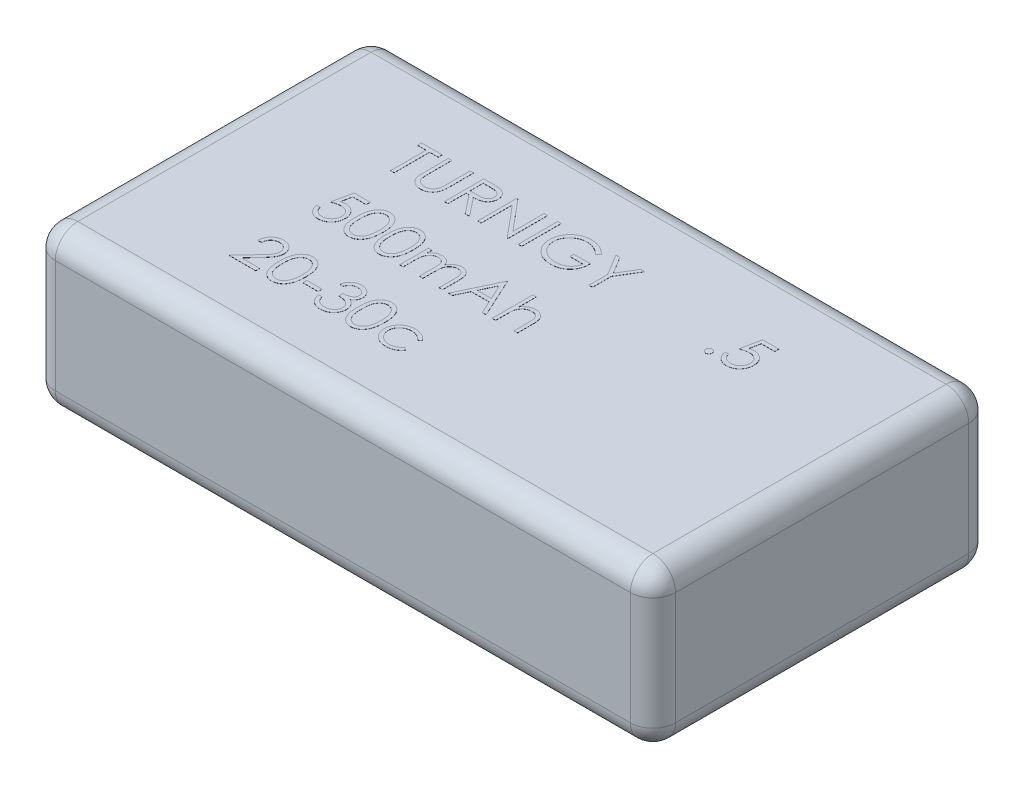
from build123d import *

# Parameters (mm, degrees)
SKETCH1_W           = 55
SKETCH1_H           = 30
BOSS_EXTRUDE1_DEPTH = 14
FILLET1_R           = 2
SKETCH4_W           = 0.314102564
SKETCH4_H           = 3.5
SKETCH4_W_2         = 1.346153846
SKETCH4_H_2         = 0.358974359
BOSS_EXTRUDE2_DEPTH = 0.01


with BuildPart() as part:
    # Sketch1 → Boss-Extrude1 (new body)
    with BuildSketch(Plane(origin=(0, 0, 0), x_dir=(1, 0, 0), z_dir=(0, 1, 0))):
        Rectangle(SKETCH1_W, SKETCH1_H)
    extrude(amount=BOSS_EXTRUDE1_DEPTH)

    # Fillet1
    fillet1_edges = [part.edges().sort_by_distance(p)[0] for p in [
        (-27.5, 7, 15),
        (27.5, 7, 15),
        (27.5, 7, -15),
        (-27.5, 7, -15),
        (0, 0, 15),
        (-27.5, 0, 0),
        (27.5, 0, 0),
        (0, 0, -15),
        (-27.5, 14, 0),
        (0, 14, 15),
        (27.5, 14, 0),
        (0, 14, -15),
    ]]
    fillet(fillet1_edges, radius=FILLET1_R)

    # Sketch4 → Boss-Extrude2 (add)
    # profile 1 of 21: a face of its own
    with BuildSketch(Plane(origin=(0, 14, 0), x_dir=(1, 0, 0), z_dir=(0, 1, 0))):
        Polygon((-16.287272911, 7.906605161), (-16.287272911, 8.26557952), (-14.447529321, 8.26557952), (-14.447529321, 7.906605161), (-15.210349834, 7.906605161), (-15.210349834, 4.76557952), (-15.524452398, 4.76557952), (-15.524452398, 7.906605161), align=None)
    # profile 2 of 21: a face of its own
    with BuildSketch(Plane(origin=(0, 14, 0), x_dir=(1, 0, 0), z_dir=(0, 1, 0))):
        with BuildLine():
            Line((-13.909067782, 8.26557952), (-13.594965218, 8.26557952))
            Line((-13.594965218, 8.26557952), (-13.594965218, 6.168524231))
            add(Edge.make_bspline(
                [(-13.594965218, 6.168524231), (-13.595011962, 6.138843496), (-13.595100667, 6.082519185), (-13.594508153, 6.002350884), (-13.592848785, 5.931078425), (-13.591802625, 5.868427078), (-13.589475292, 5.81468433), (-13.587577245, 5.769559019), (-13.585136688, 5.733264817), (-13.582203571, 5.712083891), (-13.580942782, 5.70297936)],
                knots=[0, 0, 0, 0, 1.528628734, 2.90083645, 4.128790002, 5.200304208, 6.127813768, 6.898992206, 7.526736466, 8, 8, 8, 8], degree=3))
            add(Edge.make_bspline(
                [(-13.580942782, 5.70297936), (-13.575765324, 5.670132596), (-13.565702137, 5.606289867), (-13.54005576, 5.515381585), (-13.504238259, 5.433450127), (-13.461795216, 5.357938836), (-13.405862605, 5.290949476), (-13.338859069, 5.229237823), (-13.257681301, 5.175266018), (-13.167420695, 5.125915207), (-13.070135458, 5.086250124), (-12.970724191, 5.05625676), (-12.870681212, 5.03797786), (-12.803705047, 5.035861321), (-12.770445988, 5.034810289)],
                knots=[0, 0, 0, 0, 1.035780045, 2.013197591, 2.933192213, 3.817615948, 4.702609284, 5.640816605, 6.646850145, 7.73207398, 8.84249596, 9.914020372, 10.964143139, 12, 12, 12, 12], degree=3))
            add(Edge.make_bspline(
                [(-12.770445988, 5.034810289), (-12.741892247, 5.035884139), (-12.684949685, 5.038025638), (-12.600343255, 5.051287069), (-12.517943146, 5.075187634), (-12.437342466, 5.106027393), (-12.361791482, 5.146774984), (-12.29124804, 5.193845823), (-12.228284105, 5.249056699), (-12.170826108, 5.310157044), (-12.120791172, 5.379096844), (-12.07742003, 5.454374982), (-12.0418941, 5.537124329), (-12.024350576, 5.595278751), (-12.015337815, 5.62515484)],
                knots=[0, 0, 0, 0, 0.994687771, 1.983630487, 2.973142513, 3.978332533, 4.983357753, 5.956394766, 6.925816176, 7.893390482, 8.871859704, 9.88551698, 10.913711441, 12, 12, 12, 12], degree=3))
            add(Edge.make_bspline(
                [(-12.015337815, 5.62515484), (-12.012337689, 5.637503415), (-12.005652201, 5.665021015), (-11.999405156, 5.711542305), (-11.992898631, 5.766431669), (-11.988384061, 5.830083482), (-11.98398284, 5.902284455), (-11.981349767, 5.983410712), (-11.980132735, 6.073167673), (-11.979770054, 6.135804835), (-11.979580603, 6.168524231)],
                knots=[0, 0, 0, 0, 0.558680831, 1.244966039, 2.062412453, 2.990489873, 4.051219941, 5.244515665, 6.560634259, 8, 8, 8, 8], degree=3))
            Line((-11.979580603, 6.168524231), (-11.979580603, 8.26557952))
            Line((-11.979580603, 8.26557952), (-11.665478039, 8.26557952))
            Line((-11.665478039, 8.26557952), (-11.665478039, 6.151697308))
            add(Edge.make_bspline(
                [(-11.665478039, 6.151697308), (-11.665732159, 6.113598929), (-11.666228091, 6.039247626), (-11.670528667, 5.930296267), (-11.677385667, 5.826943286), (-11.687073755, 5.72917479), (-11.699910758, 5.63734063), (-11.714185979, 5.550635862), (-11.732365512, 5.46968287), (-11.753598913, 5.393850452), (-11.777872461, 5.321664938), (-11.809313609, 5.253156324), (-11.844738109, 5.186241924), (-11.886752762, 5.121933815), (-11.933964145, 5.059947262), (-11.987415826, 5.000658187), (-12.045339986, 4.943119141), (-12.108699546, 4.888806075), (-12.176450071, 4.838997398), (-12.248390029, 4.795199627), (-12.323966799, 4.758176009), (-12.402983925, 4.727700085), (-12.485475128, 4.704785486), (-12.571442487, 4.68771033), (-12.661081681, 4.678008032), (-12.722046337, 4.676566102), (-12.752917943, 4.67583593)],
                knots=[0, 0, 0, 0, 1.316592851, 2.569410997, 3.76748051, 4.895814652, 5.963796859, 6.97159953, 7.931736103, 8.829262218, 9.692595152, 10.560224239, 11.431080259, 12.30701507, 13.211635791, 14.121146779, 15.063487852, 16.031507147, 17.00238618, 17.966455255, 18.938106653, 19.907068911, 20.888905087, 21.893141452, 22.933117798, 24, 24, 24, 24], degree=3))
            add(Edge.make_bspline(
                [(-12.752917943, 4.67583593), (-12.786587045, 4.676620695), (-12.852645704, 4.678160402), (-12.949983772, 4.686983152), (-13.043297968, 4.703601546), (-13.133573845, 4.72476149), (-13.219582342, 4.753945227), (-13.302475786, 4.788043352), (-13.380834467, 4.829920613), (-13.455929596, 4.876514006), (-13.525754352, 4.928938644), (-13.589851755, 4.986078818), (-13.648327626, 5.047019195), (-13.700196322, 5.112419561), (-13.746317207, 5.181771268), (-13.78604742, 5.255270508), (-13.820160664, 5.332888824), (-13.837767231, 5.386842024), (-13.846667943, 5.41411718)],
                knots=[0, 0, 0, 0, 1.13879206, 2.234305948, 3.301075583, 4.341971843, 5.366689343, 6.369221514, 7.369726634, 8.367512178, 9.355451585, 10.318319045, 11.268648973, 12.207971039, 13.137398894, 14.081662264, 15.030215811, 16, 16, 16, 16], degree=3))
            add(Edge.make_bspline(
                [(-13.846667943, 5.41411718), (-13.851845101, 5.432749755), (-13.863074472, 5.473164224), (-13.87509977, 5.540050712), (-13.885208852, 5.61706563), (-13.89471441, 5.704214248), (-13.900323368, 5.801564115), (-13.905240806, 5.909073031), (-13.909102425, 6.026870992), (-13.909079653, 6.108925508), (-13.909067782, 6.151697308)],
                knots=[0, 0, 0, 0, 0.625038921, 1.35572334, 2.194682327, 3.136881307, 4.189498639, 5.346923369, 6.617055217, 8, 8, 8, 8], degree=3))
            Line((-13.909067782, 6.151697308), (-13.909067782, 8.26557952))
        make_face()
    # profile 3 of 21: a face of its own
    with BuildSketch(Plane(origin=(0, 14, 0), x_dir=(1, 0, 0), z_dir=(0, 1, 0))):
        with BuildLine():
            Line((-10.768042141, 8.26557952), (-10.067621468, 8.26557952))
            add(Edge.make_bspline(
                [(-10.067621468, 8.26557952), (-10.02088034, 8.265423934), (-9.931132195, 8.265125192), (-9.802558925, 8.263459429), (-9.685731828, 8.258685073), (-9.580711989, 8.254576489), (-9.487501334, 8.247084548), (-9.405814043, 8.239923901), (-9.336026346, 8.23055024), (-9.293780494, 8.221844817), (-9.274652718, 8.217903238)],
                knots=[0, 0, 0, 0, 1.410062039, 2.707475311, 3.878576406, 4.937260626, 5.877586885, 6.699081471, 7.410979367, 8, 8, 8, 8], degree=3))
            add(Edge.make_bspline(
                [(-9.274652718, 8.217903238), (-9.249046094, 8.211576472), (-9.198379105, 8.199057909), (-9.125429039, 8.172598308), (-9.055914715, 8.141978683), (-8.99012489, 8.106014963), (-8.928389099, 8.064440183), (-8.870070788, 8.017972061), (-8.814905325, 7.966864855), (-8.765123695, 7.909830014), (-8.718184643, 7.849993504), (-8.678596017, 7.785289747), (-8.644469537, 7.71762822), (-8.61729902, 7.646320802), (-8.595421047, 7.57205903), (-8.579994807, 7.494170233), (-8.57074362, 7.413009258), (-8.569801764, 7.357651349), (-8.569324193, 7.329581924)],
                knots=[0, 0, 0, 0, 1.027469482, 2.033020251, 3.019912614, 3.986113645, 4.951240523, 5.91722682, 6.890402269, 7.87763091, 8.8651537, 9.85103654, 10.82876324, 11.815024772, 12.821070561, 13.842952187, 14.906261191, 16, 16, 16, 16], degree=3))
            add(Edge.make_bspline(
                [(-8.569324193, 7.329581924), (-8.570793191, 7.282946819), (-8.573659587, 7.191949651), (-8.60038469, 7.05988877), (-8.64416121, 6.936699455), (-8.704484499, 6.822536817), (-8.781303975, 6.719626172), (-8.873628766, 6.629235717), (-8.981510377, 6.553595804), (-9.081939693, 6.501142999), (-9.170653893, 6.467550091), (-9.243687206, 6.443913732), (-9.323354183, 6.425651767), (-9.408891518, 6.409291635), (-9.500655173, 6.39693994), (-9.598425213, 6.387893346), (-9.702271364, 6.382239297), (-9.773610434, 6.381397292), (-9.81030977, 6.380964135)],
                knots=[0, 0, 0, 0, 1.260483769, 2.459530307, 3.627416485, 4.787058657, 5.939039949, 7.08810263, 8.267026773, 9.491475466, 10.141966685, 10.831826277, 11.566392101, 12.351337768, 13.187381173, 14.07005841, 15.007169909, 16, 16, 16, 16], degree=3))
            Line((-9.81030977, 6.380964135), (-8.524452398, 4.76557952))
            Line((-8.524452398, 4.76557952), (-8.912873872, 4.76557952))
            Line((-8.912873872, 4.76557952), (-10.198731244, 6.380964135))
            Line((-10.198731244, 6.380964135), (-10.453939577, 6.380964135))
            Line((-10.453939577, 6.380964135), (-10.453939577, 4.76557952))
            Line((-10.453939577, 4.76557952), (-10.768042141, 4.76557952))
            Line((-10.768042141, 4.76557952), (-10.768042141, 8.26557952))
        make_face()
        with BuildLine():
            Line((-10.453939577, 7.906605161), (-10.453939577, 6.739938494))
            Line((-10.453939577, 6.739938494), (-9.813114257, 6.735030642))
            add(Edge.make_bspline(
                [(-9.813114257, 6.735030642), (-9.783194218, 6.735017405), (-9.725200661, 6.734991749), (-9.641299996, 6.738985525), (-9.563179884, 6.743528843), (-9.491139132, 6.750478189), (-9.425145557, 6.75943426), (-9.365232144, 6.770637245), (-9.311301092, 6.783689307), (-9.248402553, 6.803890933), (-9.178166022, 6.835896951), (-9.101834562, 6.88246245), (-9.036832224, 6.941031569), (-8.981914362, 7.008005025), (-8.937784931, 7.081641274), (-8.906672876, 7.161057643), (-8.886930434, 7.244249241), (-8.884601888, 7.301427349), (-8.883426757, 7.330283046)],
                knots=[0, 0, 0, 0, 1.146690395, 2.22261258, 3.21895312, 4.145990853, 4.996080663, 5.770904154, 6.481378293, 7.121626537, 8.300444488, 9.431385265, 10.535395872, 11.636531494, 12.74115979, 13.810798291, 14.895190096, 16, 16, 16, 16], degree=3))
            add(Edge.make_bspline(
                [(-8.883426757, 7.330283046), (-8.884628878, 7.358429619), (-8.887011043, 7.414205858), (-8.906459812, 7.495861768), (-8.939349193, 7.572928718), (-8.983671431, 7.645093203), (-9.037670586, 7.710598939), (-9.100988399, 7.766646092), (-9.171893594, 7.812895557), (-9.238164792, 7.842449937), (-9.297399005, 7.860569791), (-9.348828665, 7.873320954), (-9.406940143, 7.883565423), (-9.472015601, 7.891773484), (-9.543777232, 7.898828429), (-9.622587883, 7.903580207), (-9.707924663, 7.906394071), (-9.767071594, 7.90653316), (-9.797689577, 7.906605161)],
                knots=[0, 0, 0, 0, 1.101028733, 2.181837193, 3.264309656, 4.369019818, 5.486613113, 6.575447106, 7.666700264, 8.788928104, 9.402425223, 10.0903467, 10.862060571, 11.710948788, 12.657782767, 13.684531032, 14.801375019, 16, 16, 16, 16], degree=3))
            Line((-9.797689577, 7.906605161), (-10.453939577, 7.906605161))
        make_face(mode=Mode.SUBTRACT)
    # profile 4 of 21: a face of its own
    with BuildSketch(Plane(origin=(0, 14, 0), x_dir=(1, 0, 0), z_dir=(0, 1, 0))):
        Polygon((-7.80650368, 4.76557952), (-7.80650368, 8.26557952), (-7.740598231, 8.26557952), (-5.428298552, 5.510871988), (-5.428298552, 8.26557952), (-5.114195988, 8.26557952), (-5.114195988, 4.76557952), (-5.185710411, 4.76557952), (-7.492401116, 7.513976956), (-7.492401116, 4.76557952), align=None)
    # profile 5 of 21: a face of its own
    with BuildSketch(Plane(origin=(0, 14, 0), x_dir=(1, 0, 0), z_dir=(0, 1, 0))):
        with Locations((-4.059708808, 6.51557952)):
            Rectangle(SKETCH4_W, SKETCH4_H)
    # profile 6 of 21: a face of its own
    with BuildSketch(Plane(origin=(0, 14, 0), x_dir=(1, 0, 0), z_dir=(0, 1, 0))):
        with BuildLine():
            Line((0.270419397, 7.668223751), (0.001188628, 7.413015417))
            add(Edge.make_bspline(
                [(0.001188628, 7.413015417), (-0.04753026, 7.45884628), (-0.143806307, 7.549415143), (-0.30076655, 7.666926138), (-0.464530184, 7.767592239), (-0.63424268, 7.849498475), (-0.805701234, 7.914851235), (-0.976630011, 7.961379376), (-1.145275712, 7.991051913), (-1.25744293, 7.994600283), (-1.312713616, 7.996348751)],
                knots=[0, 0, 0, 0, 1.08915593, 2.152340314, 3.188132944, 4.216796309, 5.218260357, 6.173443236, 7.099959455, 8, 8, 8, 8], degree=3))
            add(Edge.make_bspline(
                [(-1.312713616, 7.996348751), (-1.346628316, 7.995935145), (-1.414369756, 7.995109006), (-1.5149917, 7.98456479), (-1.614558337, 7.969399926), (-1.712881712, 7.947458049), (-1.810152999, 7.919648989), (-1.906033891, 7.884863526), (-2.000703246, 7.844308282), (-2.093269327, 7.797445808), (-2.18300983, 7.745965961), (-2.267766666, 7.688917421), (-2.348080065, 7.628128631), (-2.42244049, 7.562077652), (-2.491275677, 7.491362786), (-2.556224049, 7.41729948), (-2.615001344, 7.337864262), (-2.668092509, 7.254518636), (-2.715454128, 7.168726446), (-2.757262781, 7.081313457), (-2.792359869, 6.992569602), (-2.820129325, 6.902383525), (-2.843039979, 6.811452935), (-2.859157586, 6.719148214), (-2.868244308, 6.625370529), (-2.869816088, 6.56257327), (-2.870606244, 6.531004199)],
                knots=[0, 0, 0, 0, 1.02818874, 2.053710826, 3.065248034, 4.081641283, 5.106893873, 6.131558223, 7.173050175, 8.228653731, 9.27666206, 10.308777013, 11.325269123, 12.329503258, 13.32196095, 14.316845687, 15.314881793, 16.315733098, 17.311955233, 18.285320748, 19.252783886, 20.203351036, 21.145449891, 22.095197417, 23.042428769, 24, 24, 24, 24], degree=3))
            add(Edge.make_bspline(
                [(-2.870606244, 6.531004199), (-2.869850526, 6.498733382), (-2.868341153, 6.434279869), (-2.858680833, 6.338085796), (-2.840752593, 6.243320394), (-2.816784884, 6.14967226), (-2.786804068, 6.056981013), (-2.749431402, 5.965648503), (-2.705165802, 5.875678111), (-2.65392925, 5.787880495), (-2.597743046, 5.702357471), (-2.534799965, 5.621797949), (-2.467939382, 5.545129172), (-2.394725482, 5.474053408), (-2.31750594, 5.406669512), (-2.233973664, 5.34483399), (-2.145771203, 5.287355767), (-2.052763991, 5.234959248), (-1.955961209, 5.188150712), (-1.856704456, 5.146526816), (-1.75467664, 5.112247478), (-1.650413951, 5.084309374), (-1.544040679, 5.061409077), (-1.435016876, 5.046676597), (-1.324144168, 5.035985766), (-1.249405536, 5.035204096), (-1.211752077, 5.034810289)],
                knots=[0, 0, 0, 0, 0.93586088, 1.869166235, 2.799637598, 3.729985548, 4.670839027, 5.622275134, 6.589130586, 7.576015415, 8.568469353, 9.55398029, 10.53834874, 11.515998671, 12.510579167, 13.508179873, 14.527009472, 15.561807829, 16.601455013, 17.643573243, 18.680854198, 19.719860599, 20.772568776, 21.833555941, 22.908541556, 24, 24, 24, 24], degree=3))
            add(Edge.make_bspline(
                [(-1.211752077, 5.034810289), (-1.16637373, 5.035758865), (-1.077265973, 5.037621549), (-0.94627953, 5.052121839), (-0.820476459, 5.074768632), (-0.700210256, 5.107934529), (-0.585341235, 5.150238204), (-0.475448294, 5.20123359), (-0.371396636, 5.262876649), (-0.272873462, 5.332450516), (-0.182116276, 5.409965349), (-0.100262152, 5.493609804), (-0.028616663, 5.582977871), (0.033888036, 5.677543186), (0.08559669, 5.778088491), (0.128039486, 5.884121054), (0.160572777, 5.995688565), (0.173927752, 6.072780197), (0.180675807, 6.111733366)],
                knots=[0, 0, 0, 0, 1.13008108, 2.219097802, 3.278683437, 4.311054135, 5.322181354, 6.324827112, 7.324222904, 8.330512327, 9.32562643, 10.293043162, 11.24128371, 12.174520618, 13.111833804, 14.052305215, 15.015860969, 16, 16, 16, 16], degree=3))
            Line((0.180675807, 6.111733366), (-0.985990859, 6.111733366))
            Line((-0.985990859, 6.111733366), (-0.985990859, 6.470707725))
            Line((-0.985990859, 6.470707725), (0.494778371, 6.470707725))
            add(Edge.make_bspline(
                [(0.494778371, 6.470707725), (0.493072523, 6.403800236), (0.48973387, 6.272850194), (0.466314954, 6.081879924), (0.428498442, 5.90150823), (0.37683813, 5.731545159), (0.309962849, 5.572231566), (0.228590321, 5.4234057), (0.1314182, 5.286029019), (0.021907758, 5.158980015), (-0.100992199, 5.045650803), (-0.233960819, 4.946044865), (-0.377217788, 4.86214225), (-0.530627595, 4.793881587), (-0.693688029, 4.740607592), (-0.866776408, 4.702836016), (-1.049658009, 4.680206052), (-1.174994686, 4.677314673), (-1.239095827, 4.67583593)],
                knots=[0, 0, 0, 0, 1.140356446, 2.231883559, 3.274166699, 4.278491846, 5.25512956, 6.21435461, 7.1637429, 8.11826594, 9.068280886, 10.0076534, 10.945064095, 11.891975133, 12.864533718, 13.863980011, 14.907571808, 16, 16, 16, 16], degree=3))
            add(Edge.make_bspline(
                [(-1.239095827, 4.67583593), (-1.278605963, 4.676405051), (-1.356532684, 4.677527542), (-1.471623612, 4.685504889), (-1.583541232, 4.697785466), (-1.692269241, 4.716330589), (-1.798207583, 4.739045243), (-1.900827168, 4.768131962), (-2.00051891, 4.801800661), (-2.097436896, 4.840096335), (-2.190701443, 4.884467991), (-2.28072796, 4.933777631), (-2.368014085, 4.987770992), (-2.45196525, 5.047381837), (-2.533018872, 5.112164298), (-2.610652315, 5.182248217), (-2.685300194, 5.257419336), (-2.732060657, 5.310798346), (-2.75562227, 5.337694904)],
                knots=[0, 0, 0, 0, 1.107784379, 2.184907829, 3.233506516, 4.263428166, 5.276301166, 6.270063455, 7.25232949, 8.225834625, 9.190232166, 10.146266622, 11.1027726, 12.066435141, 13.031522626, 14.010570082, 14.99756817, 16, 16, 16, 16], degree=3))
            add(Edge.make_bspline(
                [(-2.75562227, 5.337694904), (-2.789808202, 5.380365557), (-2.857612614, 5.464998575), (-2.944890771, 5.600598519), (-3.019292174, 5.741000379), (-3.079659996, 5.886595008), (-3.126798082, 6.03724622), (-3.160604335, 6.192761512), (-3.180411624, 6.353341142), (-3.183265162, 6.462006407), (-3.184708808, 6.516981763)],
                knots=[0, 0, 0, 0, 1.023165419, 2.029347347, 3.013907458, 3.994755782, 4.975994455, 5.96558838, 6.970761222, 8, 8, 8, 8], degree=3))
            add(Edge.make_bspline(
                [(-3.184708808, 6.516981763), (-3.18417657, 6.558148016), (-3.183118858, 6.639957324), (-3.170293342, 6.761414631), (-3.151891924, 6.880715323), (-3.124844869, 6.997761879), (-3.090748605, 7.112632471), (-3.048195119, 7.225380435), (-2.998650223, 7.336072307), (-2.941064727, 7.443946175), (-2.876980267, 7.547570588), (-2.807430047, 7.646528391), (-2.731426447, 7.739017456), (-2.650210647, 7.826209104), (-2.562813657, 7.907007951), (-2.470054233, 7.982162062), (-2.37186089, 8.051772248), (-2.26792471, 8.114742082), (-2.159797026, 8.171305703), (-2.047737024, 8.220894915), (-1.931778913, 8.26187823), (-1.812791436, 8.29665201), (-1.689873935, 8.32236715), (-1.563918398, 8.341015896), (-1.434268286, 8.353776495), (-1.346632257, 8.354802751), (-1.302196789, 8.35532311)],
                knots=[0, 0, 0, 0, 1.008945113, 2.00506715, 2.99143336, 3.967273523, 4.948097931, 5.927297278, 6.919902385, 7.919676788, 8.923139349, 9.905703106, 10.883022732, 11.856032218, 12.825136022, 13.798837087, 14.781400844, 15.773989409, 16.776158564, 17.77167057, 18.775803737, 19.789618931, 20.80898985, 21.851988756, 22.910860228, 24, 24, 24, 24], degree=3))
            add(Edge.make_bspline(
                [(-1.302196789, 8.35532311), (-1.265958545, 8.354743618), (-1.194102367, 8.353594554), (-1.087176634, 8.345629906), (-0.98190362, 8.333006025), (-0.87812723, 8.315779238), (-0.776200863, 8.292315548), (-0.675834158, 8.264237263), (-0.576881622, 8.23154544), (-0.479653373, 8.192556594), (-0.383495657, 8.148302969), (-0.287873816, 8.098489547), (-0.19311457, 8.042264542), (-0.099053589, 7.979461007), (-0.005097731, 7.911157589), (0.087266912, 7.835400765), (0.180269856, 7.755178009), (0.24007167, 7.697495825), (0.270419397, 7.668223751)],
                knots=[0, 0, 0, 0, 0.985871117, 1.954866573, 2.915460327, 3.869826059, 4.81536089, 5.759505086, 6.70452669, 7.649098992, 8.607881297, 9.583363685, 10.581137262, 11.603961102, 12.659522466, 13.73993555, 14.853081303, 16, 16, 16, 16], degree=3))
        make_face()
    # profile 7 of 21: a face of its own
    with BuildSketch(Plane(origin=(0, 14, 0), x_dir=(1, 0, 0), z_dir=(0, 1, 0))):
        Polygon((0.94349632, 8.26557952), (1.303171801, 8.26557952), (2.223043596, 6.76167327), (3.141513147, 8.26557952), (3.501188628, 8.26557952), (2.379393756, 6.429341539), (2.379393756, 4.76557952), (2.065291192, 4.76557952), (2.065291192, 6.429341539), align=None)
    # profile 8 of 21: a face of its own
    with BuildSketch(Plane(origin=(0, 14, 0), x_dir=(1, 0, 0), z_dir=(0, 1, 0))):
        with BuildLine():
            add(Edge.make_bspline(
                [(12.453111705, 5.304041058), (12.472601917, 5.302882892), (12.510810199, 5.300612441), (12.566049328, 5.285035767), (12.616043987, 5.257377107), (12.660576232, 5.220514329), (12.697282709, 5.175818666), (12.725927061, 5.126222757), (12.741368046, 5.070521164), (12.743621958, 5.032091489), (12.744778371, 5.012374392)],
                knots=[0, 0, 0, 0, 1.020151414, 1.999887582, 2.974338812, 3.990962822, 5.007586832, 5.987933904, 6.967670073, 8, 8, 8, 8], degree=3))
            add(Edge.make_bspline(
                [(12.744778371, 5.012374392), (12.743582771, 4.993131062), (12.741225063, 4.955183498), (12.725962455, 4.899902036), (12.697064405, 4.850275131), (12.660829412, 4.804972993), (12.616032979, 4.768032122), (12.565931132, 4.740608778), (12.510939874, 4.723916798), (12.472623551, 4.721790501), (12.453111705, 4.720707725)],
                knots=[0, 0, 0, 0, 1.009421747, 1.99056486, 2.972319754, 3.999869655, 5.017953583, 5.993804169, 6.978383603, 8, 8, 8, 8], degree=3))
            add(Edge.make_bspline(
                [(12.453111705, 4.720707725), (12.433585799, 4.721751322), (12.395466116, 4.723788697), (12.340680122, 4.740951504), (12.290273154, 4.767774964), (12.245485442, 4.805041873), (12.20894697, 4.850042017), (12.181321587, 4.900243813), (12.164731438, 4.95502525), (12.162549566, 4.993099893), (12.161445038, 5.012374392)],
                knots=[0, 0, 0, 0, 1.022052826, 1.995314843, 2.982371812, 4.00089066, 5.028879526, 6.005146991, 6.990147033, 8, 8, 8, 8], degree=3))
            add(Edge.make_bspline(
                [(12.161445038, 5.012374392), (12.162507137, 5.032123771), (12.164580756, 5.070682011), (12.181356416, 5.125881119), (12.208732628, 5.176049558), (12.245738023, 5.220446138), (12.290262319, 5.257633441), (12.340558524, 5.284698234), (12.395598064, 5.300738646), (12.433608003, 5.302921163), (12.453111705, 5.304041058)],
                knots=[0, 0, 0, 0, 1.032775665, 2.016367738, 2.991239715, 4.008302682, 5.025365648, 6.011011707, 6.979408107, 8, 8, 8, 8], degree=3))
        make_face()
    # profile 9 of 21: a face of its own
    with BuildSketch(Plane(origin=(0, 14, 0), x_dir=(1, 0, 0), z_dir=(0, 1, 0))):
        with BuildLine():
            Line((15.392214269, 8.26557952), (15.392214269, 7.906605161))
            Line((15.392214269, 7.906605161), (14.201709461, 7.906605161))
            Line((14.201709461, 7.906605161), (14.013107698, 6.986032244))
            add(Edge.make_bspline(
                [(14.013107698, 6.986032244), (14.050163573, 6.996262516), (14.121953468, 7.01608205), (14.227913329, 7.03808782), (14.328505533, 7.051353264), (14.393780903, 7.053164575), (14.425367314, 7.054041058)],
                knots=[0, 0, 0, 0, 1.100273476, 2.13160584, 3.095893838, 4, 4, 4, 4], degree=3))
            add(Edge.make_bspline(
                [(14.425367314, 7.054041058), (14.464451053, 7.053195123), (14.541299451, 7.051531802), (14.653738398, 7.035559952), (14.761071291, 7.010420038), (14.863073661, 6.975299516), (14.959934212, 6.930389783), (15.050761773, 6.874289842), (15.136919686, 6.808756511), (15.21686228, 6.733411499), (15.289386588, 6.650489882), (15.353152578, 6.561332011), (15.407315168, 6.466804349), (15.450875923, 6.366003741), (15.485660257, 6.260044587), (15.508812252, 6.147812005), (15.524228961, 6.030363885), (15.525951348, 5.950059315), (15.526829653, 5.909109167)],
                knots=[0, 0, 0, 0, 1.052922333, 2.070308379, 3.05430497, 4.020497103, 4.973039431, 5.925935799, 6.892292201, 7.88610001, 8.88166317, 9.857072816, 10.836096531, 11.812156883, 12.81219415, 13.836441305, 14.89672472, 16, 16, 16, 16], degree=3))
            add(Edge.make_bspline(
                [(15.526829653, 5.909109167), (15.526164578, 5.880586947), (15.524843415, 5.823927959), (15.518124828, 5.739783759), (15.505189112, 5.657420926), (15.487821388, 5.576828534), (15.46527897, 5.498159162), (15.437989916, 5.421187634), (15.404593888, 5.346393027), (15.367962513, 5.273067632), (15.326716035, 5.202869125), (15.280937528, 5.137220138), (15.232572036, 5.075135857), (15.180530651, 5.017282124), (15.124329656, 4.964039106), (15.064649689, 4.915090824), (15.00196697, 4.869609494), (14.935311728, 4.829441299), (14.866169245, 4.792478343), (14.793541028, 4.762154805), (14.719080327, 4.735044277), (14.641715452, 4.71343475), (14.561621639, 4.696502195), (14.478666863, 4.685001594), (14.393286193, 4.676625157), (14.335411181, 4.6761008), (14.306176609, 4.67583593)],
                knots=[0, 0, 0, 0, 1.056347294, 2.098418968, 3.122841568, 4.141288669, 5.149314143, 6.15115421, 7.162517403, 8.180376062, 9.185164535, 10.17417709, 11.141909838, 12.097768115, 13.052685741, 14.0056014, 14.954263652, 15.917497458, 16.885230207, 17.854509472, 18.828990115, 19.81800267, 20.826176721, 21.857883937, 22.917946725, 24, 24, 24, 24], degree=3))
            add(Edge.make_bspline(
                [(14.306176609, 4.67583593), (14.271302428, 4.676526768), (14.202691597, 4.67788591), (14.10217103, 4.692104395), (14.005456424, 4.712468312), (13.913326323, 4.743104582), (13.824955059, 4.781491876), (13.741532342, 4.830008048), (13.660926566, 4.884987152), (13.586414529, 4.949867505), (13.517258415, 5.020783187), (13.455351907, 5.097740828), (13.40021833, 5.17947027), (13.352740583, 5.266368424), (13.312242562, 5.358206955), (13.280427573, 5.455329956), (13.254749218, 5.55722996), (13.243885798, 5.62738347), (13.238368115, 5.663015417)],
                knots=[0, 0, 0, 0, 1.0467383, 2.05933395, 3.04377827, 4.011590433, 4.970194871, 5.932262533, 6.905835911, 7.896367577, 8.894135286, 9.877477877, 10.858688626, 11.851381753, 12.8477658, 13.868841284, 14.917554742, 16, 16, 16, 16], degree=3))
            Line((13.238368115, 5.663015417), (13.552470679, 5.663015417))
            add(Edge.make_bspline(
                [(13.552470679, 5.663015417), (13.560199236, 5.629638965), (13.575053953, 5.56548757), (13.607659702, 5.475356229), (13.647525577, 5.395037005), (13.694929926, 5.323467422), (13.751479956, 5.261058424), (13.816009385, 5.205441362), (13.888357108, 5.155266233), (13.968750338, 5.113443466), (14.053563417, 5.077774713), (14.142330627, 5.054023018), (14.232634973, 5.037322125), (14.293713344, 5.035650364), (14.324405775, 5.034810289)],
                knots=[0, 0, 0, 0, 1.136247022, 2.183929868, 3.172523383, 4.106158343, 5.02341133, 5.958108904, 6.928429099, 7.938127109, 8.96079061, 9.975095812, 10.982467395, 12, 12, 12, 12], degree=3))
            add(Edge.make_bspline(
                [(14.324405775, 5.034810289), (14.35436422, 5.035631067), (14.413352642, 5.037247185), (14.500164028, 5.049686198), (14.583976903, 5.068843769), (14.663964259, 5.097513624), (14.741525799, 5.132358342), (14.814699569, 5.177073418), (14.885602447, 5.228533436), (14.95203058, 5.287490067), (15.012870029, 5.352459761), (15.066626151, 5.421937155), (15.111403064, 5.496054001), (15.149137173, 5.573527154), (15.177790472, 5.655205711), (15.198231453, 5.740706886), (15.210234512, 5.830241867), (15.211885692, 5.891311176), (15.212727089, 5.922430481)],
                knots=[0, 0, 0, 0, 1.027316725, 2.022795036, 3.002884548, 3.971462791, 4.93288096, 5.914575861, 6.907176829, 7.935150275, 8.956128384, 9.956726525, 10.942570165, 11.921478529, 12.907843606, 13.90538589, 14.932640048, 16, 16, 16, 16], degree=3))
            add(Edge.make_bspline(
                [(15.212727089, 5.922430481), (15.21206861, 5.950506233), (15.21077973, 6.005460522), (15.20024916, 6.085859729), (15.181932187, 6.161932771), (15.156508307, 6.234047005), (15.1242288, 6.302270447), (15.084782487, 6.366673507), (15.037429089, 6.426407341), (14.983337201, 6.481499894), (14.92407916, 6.532344769), (14.858635417, 6.575688856), (14.78837549, 6.612152773), (14.714145891, 6.643620771), (14.634180992, 6.666221517), (14.55006436, 6.683189402), (14.460887652, 6.693004765), (14.399916964, 6.694366653), (14.368576448, 6.695066699)],
                knots=[0, 0, 0, 0, 1.045622112, 2.046656509, 3.013763289, 3.955457236, 4.890082067, 5.820317437, 6.762574623, 7.722996705, 8.69280354, 9.665887285, 10.63943826, 11.638615906, 12.663482002, 13.728887084, 14.832589034, 16, 16, 16, 16], degree=3))
            add(Edge.make_bspline(
                [(14.368576448, 6.695066699), (14.341447519, 6.694486108), (14.285433164, 6.693287335), (14.199510337, 6.684460838), (14.109218614, 6.670221544), (14.014904119, 6.650635296), (13.916283611, 6.625004219), (13.81356521, 6.594289719), (13.706532943, 6.55756772), (13.634415219, 6.529835506), (13.597342474, 6.51557952)],
                knots=[0, 0, 0, 0, 0.817624296, 1.688186739, 2.600797293, 3.572016777, 4.590301741, 5.671205678, 6.80286297, 8, 8, 8, 8], degree=3))
            Line((13.597342474, 6.51557952), (13.956316833, 8.26557952))
            Line((13.956316833, 8.26557952), (15.392214269, 8.26557952))
        make_face()
    # profile 10 of 21: a face of its own
    with BuildSketch(Plane(origin=(0, 14, 0), x_dir=(1, 0, 0), z_dir=(0, 1, 0))):
        with BuildLine():
            Line((-13.998811372, 1.432246187), (-13.998811372, 1.073271828))
            Line((-13.998811372, 1.073271828), (-15.18931618, 1.073271828))
            Line((-15.18931618, 1.073271828), (-15.377917943, 0.152698911))
            add(Edge.make_bspline(
                [(-15.377917943, 0.152698911), (-15.340862068, 0.162929183), (-15.269072173, 0.182748716), (-15.163112312, 0.204754487), (-15.062520108, 0.218019931), (-14.997244738, 0.219831241), (-14.965658327, 0.220707725)],
                knots=[0, 0, 0, 0, 1.100273476, 2.13160584, 3.095893838, 4, 4, 4, 4], degree=3))
            add(Edge.make_bspline(
                [(-14.965658327, 0.220707725), (-14.926574588, 0.219861789), (-14.84972619, 0.218198468), (-14.737287243, 0.202226619), (-14.62995435, 0.177086704), (-14.52795198, 0.141966183), (-14.431091429, 0.097056449), (-14.340263868, 0.040956509), (-14.254105955, -0.024576822), (-14.174163361, -0.099921834), (-14.101639053, -0.182843451), (-14.037873063, -0.272001322), (-13.983710473, -0.366528984), (-13.940149718, -0.467329593), (-13.905365384, -0.573288746), (-13.882213389, -0.685521329), (-13.86679668, -0.802969449), (-13.865074293, -0.883274019), (-13.864195988, -0.924224166)],
                knots=[0, 0, 0, 0, 1.052922333, 2.070308379, 3.05430497, 4.020497103, 4.973039431, 5.925935799, 6.892292201, 7.88610001, 8.88166317, 9.857072816, 10.836096531, 11.812156883, 12.81219415, 13.836441305, 14.89672472, 16, 16, 16, 16], degree=3))
            add(Edge.make_bspline(
                [(-13.864195988, -0.924224166), (-13.864861063, -0.952746386), (-13.866182226, -1.009405374), (-13.872900813, -1.093549575), (-13.885836529, -1.175912408), (-13.903204253, -1.2565048), (-13.925746671, -1.335174172), (-13.953035725, -1.4121457), (-13.986431753, -1.486940306), (-14.023063128, -1.560265701), (-14.064309606, -1.630464209), (-14.110088113, -1.696113195), (-14.158453605, -1.758197477), (-14.21049499, -1.81605121), (-14.266695985, -1.869294228), (-14.326375952, -1.918242509), (-14.389058671, -1.963723839), (-14.455713913, -2.003892035), (-14.524856396, -2.040854991), (-14.597484613, -2.071178528), (-14.671945314, -2.098289056), (-14.74931019, -2.119898584), (-14.829404002, -2.136831138), (-14.912358778, -2.148331739), (-14.997739448, -2.156708176), (-15.05561446, -2.157232533), (-15.084849032, -2.157497403)],
                knots=[0, 0, 0, 0, 1.056347294, 2.098418968, 3.122841568, 4.141288669, 5.149314143, 6.15115421, 7.162517403, 8.180376062, 9.185164535, 10.17417709, 11.141909838, 12.097768115, 13.052685741, 14.0056014, 14.954263652, 15.917497458, 16.885230207, 17.854509472, 18.828990115, 19.81800267, 20.826176721, 21.857883937, 22.917946725, 24, 24, 24, 24], degree=3))
            add(Edge.make_bspline(
                [(-15.084849032, -2.157497403), (-15.119723213, -2.156806565), (-15.188334044, -2.155447423), (-15.288854611, -2.141228938), (-15.385569217, -2.120865021), (-15.477699318, -2.090228752), (-15.566070582, -2.051841457), (-15.649493299, -2.003325285), (-15.730099075, -1.948346182), (-15.804611112, -1.883465829), (-15.873767226, -1.812550147), (-15.935673734, -1.735592506), (-15.990807311, -1.653863063), (-16.038285058, -1.566964909), (-16.078783079, -1.475126378), (-16.110598068, -1.378003378), (-16.136276423, -1.276103374), (-16.147139843, -1.205949863), (-16.152657526, -1.170317916)],
                knots=[0, 0, 0, 0, 1.0467383, 2.05933395, 3.04377827, 4.011590433, 4.970194871, 5.932262533, 6.905835911, 7.896367577, 8.894135286, 9.877477877, 10.858688626, 11.851381753, 12.8477658, 13.868841284, 14.917554742, 16, 16, 16, 16], degree=3))
            Line((-16.152657526, -1.170317916), (-15.838554962, -1.170317916))
            add(Edge.make_bspline(
                [(-15.838554962, -1.170317916), (-15.830826405, -1.203694368), (-15.815971688, -1.267845763), (-15.783365939, -1.357977105), (-15.743500064, -1.438296328), (-15.696095716, -1.509865912), (-15.639545685, -1.572274909), (-15.575016256, -1.627891971), (-15.502668533, -1.6780671), (-15.422275303, -1.719889867), (-15.337462224, -1.755558621), (-15.248695014, -1.779310316), (-15.158390668, -1.796011209), (-15.097312297, -1.797682969), (-15.066619866, -1.798523044)],
                knots=[0, 0, 0, 0, 1.136247022, 2.183929868, 3.172523383, 4.106158343, 5.02341133, 5.958108904, 6.928429099, 7.938127109, 8.96079061, 9.975095812, 10.982467395, 12, 12, 12, 12], degree=3))
            add(Edge.make_bspline(
                [(-15.066619866, -1.798523044), (-15.036661421, -1.797702266), (-14.977672999, -1.796086148), (-14.890861613, -1.783647136), (-14.807048738, -1.764489565), (-14.727061382, -1.73581971), (-14.649499842, -1.700974991), (-14.576326072, -1.656259915), (-14.505423194, -1.604799897), (-14.438995061, -1.545843267), (-14.378155612, -1.480873572), (-14.324399491, -1.411396179), (-14.279622577, -1.337279332), (-14.241888468, -1.259806179), (-14.213235169, -1.178127622), (-14.192794188, -1.092626447), (-14.180791129, -1.003091467), (-14.179139949, -0.942022157), (-14.178298552, -0.910902852)],
                knots=[0, 0, 0, 0, 1.027316725, 2.022795036, 3.002884548, 3.971462791, 4.93288096, 5.914575861, 6.907176829, 7.935150275, 8.956128384, 9.956726525, 10.942570165, 11.921478529, 12.907843606, 13.90538589, 14.932640048, 16, 16, 16, 16], degree=3))
            add(Edge.make_bspline(
                [(-14.178298552, -0.910902852), (-14.178957031, -0.8828271), (-14.180245911, -0.827872811), (-14.190776481, -0.747473605), (-14.209093454, -0.671400563), (-14.234517334, -0.599286329), (-14.266796841, -0.531062886), (-14.306243154, -0.466659826), (-14.353596552, -0.406925993), (-14.40768844, -0.351833439), (-14.466946481, -0.300988564), (-14.532390224, -0.257644478), (-14.602650151, -0.22118056), (-14.67687975, -0.189712562), (-14.756844649, -0.167111816), (-14.840961281, -0.150143931), (-14.930137989, -0.140328568), (-14.991108677, -0.13896668), (-15.022449193, -0.138266634)],
                knots=[0, 0, 0, 0, 1.045622112, 2.046656509, 3.013763289, 3.955457236, 4.890082067, 5.820317437, 6.762574623, 7.722996705, 8.69280354, 9.665887285, 10.63943826, 11.638615906, 12.663482002, 13.728887084, 14.832589034, 16, 16, 16, 16], degree=3))
            add(Edge.make_bspline(
                [(-15.022449193, -0.138266634), (-15.049578122, -0.138847225), (-15.105592477, -0.140045999), (-15.191515304, -0.148872495), (-15.281807027, -0.16311179), (-15.376121522, -0.182698037), (-15.47474203, -0.208329114), (-15.577460431, -0.239043615), (-15.684492698, -0.275765613), (-15.756610422, -0.303497827), (-15.793683167, -0.317753813)],
                knots=[0, 0, 0, 0, 0.817624296, 1.688186739, 2.600797293, 3.572016777, 4.590301741, 5.671205678, 6.80286297, 8, 8, 8, 8], degree=3))
            Line((-15.793683167, -0.317753813), (-15.434708808, 1.432246187))
            Line((-15.434708808, 1.432246187), (-13.998811372, 1.432246187))
        make_face()
    # profile 11 of 21: a face of its own
    with BuildSketch(Plane(origin=(0, 14, 0), x_dir=(1, 0, 0), z_dir=(0, 1, 0))):
        with BuildLine():
            add(Edge.make_bspline(
                [(-13.505221629, -0.319156057), (-13.50489361, -0.263058669), (-13.50425643, -0.154088685), (-13.49716801, 0.004695957), (-13.485392667, 0.153656246), (-13.469255294, 0.292799312), (-13.449617314, 0.422161077), (-13.423401828, 0.541395834), (-13.393589025, 0.65105544), (-13.359036579, 0.751497489), (-13.32004879, 0.844075192), (-13.277614529, 0.930500393), (-13.230049735, 1.010642325), (-13.180072822, 1.085780116), (-13.12566075, 1.154683811), (-13.06836196, 1.218326473), (-13.005940084, 1.275237224), (-12.940517075, 1.327083526), (-12.871500611, 1.372532998), (-12.800857945, 1.412565736), (-12.728102839, 1.446765604), (-12.653036656, 1.473656039), (-12.576334098, 1.495866886), (-12.497727032, 1.511055834), (-12.417085668, 1.520612742), (-12.362654233, 1.52152641), (-12.335049353, 1.521989776)],
                knots=[0, 0, 0, 0, 1.646270934, 3.197905019, 4.663502075, 6.030701355, 7.308322542, 8.50163776, 9.611534131, 10.641858119, 11.616356847, 12.558055219, 13.465016945, 14.349605745, 15.204443733, 16.039544428, 16.859896111, 17.680448484, 18.487036065, 19.28249412, 20.06191084, 20.843045899, 21.620316918, 22.403196591, 23.190181807, 24, 24, 24, 24], degree=3))
            add(Edge.make_bspline(
                [(-12.335049353, 1.521989776), (-12.307213875, 1.521501961), (-12.251857866, 1.52053185), (-12.17001749, 1.511207908), (-12.090067809, 1.495736785), (-12.01234967, 1.47381581), (-11.936224683, 1.446620133), (-11.862288276, 1.412533016), (-11.790081194, 1.372854149), (-11.720750907, 1.326230272), (-11.653536291, 1.274247995), (-11.590088328, 1.215485327), (-11.530401242, 1.150535607), (-11.473725937, 1.080093743), (-11.42167034, 1.002808659), (-11.372096908, 0.920024549), (-11.327724872, 0.830293684), (-11.284990197, 0.735113216), (-11.24810321, 0.631849557), (-11.214836965, 0.521084797), (-11.187957996, 0.40151061), (-11.165568724, 0.273754365), (-11.148223828, 0.137346881), (-11.135591186, -0.007419434), (-11.128918101, -0.160639825), (-11.127661399, -0.265397674), (-11.1270165, -0.319156057)],
                knots=[0, 0, 0, 0, 0.810914788, 1.612654377, 2.396697861, 3.181598691, 3.963628158, 4.749916497, 5.551656086, 6.361998678, 7.18212741, 8.025565596, 8.878627764, 9.750805457, 10.657531673, 11.591944965, 12.560506719, 13.57287815, 14.630710178, 15.753379473, 16.941251878, 18.199788006, 19.531962791, 20.947069417, 22.433333509, 24, 24, 24, 24], degree=3))
            add(Edge.make_bspline(
                [(-11.1270165, -0.319156057), (-11.127668085, -0.372679965), (-11.128937671, -0.476969117), (-11.135516378, -0.629500092), (-11.148475009, -0.773498135), (-11.164684997, -0.909308598), (-11.18713596, -1.036366217), (-11.214741126, -1.155110665), (-11.245391449, -1.266054737), (-11.283226243, -1.368289549), (-11.324636954, -1.463241271), (-11.36969215, -1.55190842), (-11.417961976, -1.635074712), (-11.470550721, -1.712074459), (-11.526604134, -1.783453116), (-11.587321923, -1.847950739), (-11.650992508, -1.907121411), (-11.718404924, -1.959773038), (-11.788816475, -2.005857843), (-11.860775552, -2.047071693), (-11.935558935, -2.080304389), (-12.011471888, -2.10883943), (-12.089600254, -2.130639881), (-12.169846645, -2.145713737), (-12.251802881, -2.156285585), (-12.307204446, -2.157092065), (-12.335049353, -2.157497403)],
                knots=[0, 0, 0, 0, 1.561518951, 3.042555995, 4.452378317, 5.7783523, 7.031515105, 8.214008947, 9.334062868, 10.386615937, 11.391082383, 12.354592575, 13.286541444, 14.194233754, 15.072674879, 15.931287219, 16.775624067, 17.606195743, 18.42308326, 19.229000347, 20.022332153, 20.807536673, 21.593273796, 22.3848459, 23.188221202, 24, 24, 24, 24], degree=3))
            add(Edge.make_bspline(
                [(-12.335049353, -2.157497403), (-12.362653467, -2.157031048), (-12.417083392, -2.156111486), (-12.497735817, -2.146597754), (-12.576018261, -2.131302251), (-12.652317015, -2.109885647), (-12.72702353, -2.083670811), (-12.799119816, -2.049517127), (-12.8694075, -2.010183058), (-12.937699056, -1.965387637), (-13.002711217, -1.914065954), (-13.064809822, -1.857301665), (-13.122434842, -1.793678254), (-13.176068937, -1.72420033), (-13.227043025, -1.649507088), (-13.273932399, -1.568578715), (-13.317303253, -1.481736105), (-13.356946743, -1.388418194), (-13.392095407, -1.287263266), (-13.423143115, -1.177114088), (-13.447657273, -1.056998451), (-13.468640228, -0.927881084), (-13.485564611, -0.789207154), (-13.497118936, -0.640901376), (-13.504260251, -0.483056167), (-13.504895322, -0.374786393), (-13.505221629, -0.319156057)],
                knots=[0, 0, 0, 0, 0.810891512, 1.598919785, 2.382837074, 3.152667961, 3.926044502, 4.706494248, 5.493654104, 6.291793342, 7.103789334, 7.925228297, 8.761435821, 9.622817696, 10.50288917, 11.416980706, 12.369136599, 13.353924996, 14.394355917, 15.514179734, 16.714354668, 17.994756427, 19.357759367, 20.818452758, 22.365282078, 24, 24, 24, 24], degree=3))
        make_face()
        with BuildLine():
            add(Edge.make_bspline(
                [(-13.191119065, -0.317753813), (-13.190999617, -0.364502512), (-13.190767794, -0.455232557), (-13.184711594, -0.587075818), (-13.176461362, -0.710046147), (-13.165820064, -0.824299683), (-13.150017116, -0.929449696), (-13.132310328, -1.026219379), (-13.110762238, -1.114096616), (-13.085267221, -1.193684427), (-13.056228124, -1.266333495), (-13.02452226, -1.33393471), (-12.990461537, -1.397286647), (-12.952342387, -1.455820255), (-12.910827323, -1.509726419), (-12.866854064, -1.559959252), (-12.81878148, -1.604756233), (-12.752277737, -1.658483088), (-12.664481263, -1.714002222), (-12.553860808, -1.762348311), (-12.440192357, -1.792730768), (-12.363041107, -1.796594524), (-12.324532526, -1.798523044)],
                knots=[0, 0, 0, 0, 1.459021318, 2.831673884, 4.118529203, 5.306027144, 6.411944654, 7.436330062, 8.375795394, 9.233974572, 10.042671642, 10.816086306, 11.563610507, 12.285937304, 12.993564865, 13.685989202, 14.367179055, 15.041617293, 16.353048772, 17.594441528, 18.799311195, 20, 20, 20, 20], degree=3))
            add(Edge.make_bspline(
                [(-12.324532526, -1.798523044), (-12.285774854, -1.796925263), (-12.208339531, -1.793733001), (-12.095205736, -1.762934263), (-11.985375466, -1.716464724), (-11.899303526, -1.661517218), (-11.833820982, -1.609188889), (-11.786903992, -1.564574241), (-11.743841944, -1.514618373), (-11.702999869, -1.460719077), (-11.665540793, -1.401846593), (-11.631477655, -1.338284018), (-11.600394308, -1.26985484), (-11.582685262, -1.222085101), (-11.573631084, -1.197661666)],
                knots=[0, 0, 0, 0, 1.353760809, 2.704726607, 4.075137775, 5.516104923, 6.260822281, 7.007110065, 7.778089737, 8.566572457, 9.372053459, 10.217411131, 11.088608312, 12, 12, 12, 12], degree=3))
            add(Edge.make_bspline(
                [(-11.573631084, -1.197661666), (-11.563079316, -1.166431927), (-11.541654702, -1.103022162), (-11.514042928, -1.00465851), (-11.492297529, -0.901455746), (-11.472734163, -0.79403063), (-11.459381107, -0.681590929), (-11.448633294, -0.564484545), (-11.442302607, -0.442623182), (-11.441517856, -0.359828191), (-11.441119065, -0.317753813)],
                knots=[0, 0, 0, 0, 0.884706709, 1.796334032, 2.740027952, 3.714592787, 4.726048262, 5.777819803, 6.87074269, 8, 8, 8, 8], degree=3))
            add(Edge.make_bspline(
                [(-11.441119065, -0.317753813), (-11.441669254, -0.275686241), (-11.442745542, -0.193393076), (-11.446859529, -0.072874896), (-11.457483104, 0.041592865), (-11.469282223, 0.150503338), (-11.486679444, 0.253253641), (-11.505437251, 0.350703946), (-11.530638463, 0.441646971), (-11.557558238, 0.527506553), (-11.588368633, 0.607307207), (-11.622284368, 0.681420993), (-11.658506126, 0.750205718), (-11.697848367, 0.81347266), (-11.73984405, 0.871505203), (-11.785601599, 0.923139797), (-11.833305972, 0.969976765), (-11.900123158, 1.023439334), (-11.987597448, 1.07795103), (-12.096443095, 1.12811679), (-12.209713739, 1.156925082), (-12.286287193, 1.160986769), (-12.324532526, 1.163015417)],
                knots=[0, 0, 0, 0, 1.31362396, 2.569729283, 3.763502607, 4.902122613, 5.988968491, 7.01645872, 7.998833611, 8.933434873, 9.825090667, 10.667526885, 11.477055099, 12.250526234, 12.991942729, 13.710640831, 14.402115721, 15.076753259, 16.378508321, 17.609869233, 18.806226677, 20, 20, 20, 20], degree=3))
            add(Edge.make_bspline(
                [(-12.324532526, 1.163015417), (-12.363243118, 1.160983971), (-12.440734824, 1.156917377), (-12.555182779, 1.128224123), (-12.66488713, 1.078211157), (-12.752130105, 1.023258785), (-12.818993891, 0.970920473), (-12.866076585, 0.925534019), (-12.910222757, 0.875887765), (-12.950890457, 0.82148585), (-12.98897974, 0.763020483), (-13.023960753, 0.700031718), (-13.055478083, 0.632200354), (-13.084562619, 0.559583918), (-13.110135407, 0.480002974), (-13.13122937, 0.39223398), (-13.150716423, 0.295772088), (-13.164511692, 0.19005258), (-13.176775448, 0.075770427), (-13.184656796, -0.047506891), (-13.190788053, -0.179571272), (-13.191006518, -0.27077043), (-13.191119065, -0.317753813)],
                knots=[0, 0, 0, 0, 1.207732386, 2.417664972, 3.655092373, 4.956220595, 5.625982001, 6.301752483, 6.994047911, 7.697131622, 8.419323945, 9.170223765, 9.943494443, 10.752040957, 11.610060368, 12.549350801, 13.567764191, 14.679664412, 15.874934091, 17.154273443, 18.533957287, 20, 20, 20, 20], degree=3))
        make_face(mode=Mode.SUBTRACT)
    # profile 12 of 21: a face of its own
    with BuildSketch(Plane(origin=(0, 14, 0), x_dir=(1, 0, 0), z_dir=(0, 1, 0))):
        with BuildLine():
            add(Edge.make_bspline(
                [(-10.812913936, -0.319156057), (-10.812585918, -0.263058669), (-10.811948738, -0.154088685), (-10.804860317, 0.004695957), (-10.793084975, 0.153656246), (-10.776947602, 0.292799312), (-10.757309622, 0.422161077), (-10.731094135, 0.541395834), (-10.701281333, 0.65105544), (-10.666728887, 0.751497489), (-10.627741098, 0.844075192), (-10.585306837, 0.930500393), (-10.537742043, 1.010642325), (-10.48776513, 1.085780116), (-10.433353058, 1.154683811), (-10.376054268, 1.218326473), (-10.313632391, 1.275237224), (-10.248209383, 1.327083526), (-10.179192919, 1.372532998), (-10.108550253, 1.412565736), (-10.035795147, 1.446765604), (-9.960728964, 1.473656039), (-9.884026406, 1.495866886), (-9.805419339, 1.511055834), (-9.724777975, 1.520612742), (-9.67034654, 1.52152641), (-9.642741661, 1.521989776)],
                knots=[0, 0, 0, 0, 1.646270934, 3.197905019, 4.663502075, 6.030701355, 7.308322542, 8.50163776, 9.611534131, 10.641858119, 11.616356847, 12.558055219, 13.465016945, 14.349605745, 15.204443733, 16.039544428, 16.859896111, 17.680448484, 18.487036065, 19.28249412, 20.06191084, 20.843045899, 21.620316918, 22.403196591, 23.190181807, 24, 24, 24, 24], degree=3))
            add(Edge.make_bspline(
                [(-9.642741661, 1.521989776), (-9.614906182, 1.521501961), (-9.559550173, 1.52053185), (-9.477709798, 1.511207908), (-9.397760116, 1.495736785), (-9.320041978, 1.47381581), (-9.243916991, 1.446620133), (-9.169980584, 1.412533016), (-9.097773502, 1.372854149), (-9.028443214, 1.326230272), (-8.961228599, 1.274247995), (-8.897780636, 1.215485327), (-8.83809355, 1.150535607), (-8.781418245, 1.080093743), (-8.729362648, 1.002808659), (-8.679789215, 0.920024549), (-8.635417179, 0.830293684), (-8.592682504, 0.735113216), (-8.555795518, 0.631849557), (-8.522529272, 0.521084797), (-8.495650304, 0.40151061), (-8.473261031, 0.273754365), (-8.455916135, 0.137346881), (-8.443283493, -0.007419434), (-8.436610408, -0.160639825), (-8.435353707, -0.265397674), (-8.434708808, -0.319156057)],
                knots=[0, 0, 0, 0, 0.810914788, 1.612654377, 2.396697861, 3.181598691, 3.963628158, 4.749916497, 5.551656086, 6.361998678, 7.18212741, 8.025565596, 8.878627764, 9.750805457, 10.657531673, 11.591944965, 12.560506719, 13.57287815, 14.630710178, 15.753379473, 16.941251878, 18.199788006, 19.531962791, 20.947069417, 22.433333509, 24, 24, 24, 24], degree=3))
            add(Edge.make_bspline(
                [(-8.434708808, -0.319156057), (-8.435360393, -0.372679965), (-8.436629979, -0.476969117), (-8.443208685, -0.629500092), (-8.456167317, -0.773498135), (-8.472377305, -0.909308598), (-8.494828268, -1.036366217), (-8.522433434, -1.155110665), (-8.553083757, -1.266054737), (-8.590918551, -1.368289549), (-8.632329261, -1.463241271), (-8.677384458, -1.55190842), (-8.725654284, -1.635074712), (-8.778243029, -1.712074459), (-8.834296442, -1.783453116), (-8.895014231, -1.847950739), (-8.958684816, -1.907121411), (-9.026097232, -1.959773038), (-9.096508783, -2.005857843), (-9.16846786, -2.047071693), (-9.243251243, -2.080304389), (-9.319164196, -2.10883943), (-9.397292562, -2.130639881), (-9.477538953, -2.145713737), (-9.559495189, -2.156285585), (-9.614896754, -2.157092065), (-9.642741661, -2.157497403)],
                knots=[0, 0, 0, 0, 1.561518951, 3.042555995, 4.452378317, 5.7783523, 7.031515105, 8.214008947, 9.334062868, 10.386615937, 11.391082383, 12.354592575, 13.286541444, 14.194233754, 15.072674879, 15.931287219, 16.775624067, 17.606195743, 18.42308326, 19.229000347, 20.022332153, 20.807536673, 21.593273796, 22.3848459, 23.188221202, 24, 24, 24, 24], degree=3))
            add(Edge.make_bspline(
                [(-9.642741661, -2.157497403), (-9.670345775, -2.157031048), (-9.724775699, -2.156111486), (-9.805428125, -2.146597754), (-9.883710568, -2.131302251), (-9.960009322, -2.109885647), (-10.034715837, -2.083670811), (-10.106812124, -2.049517127), (-10.177099808, -2.010183058), (-10.245391364, -1.965387637), (-10.310403525, -1.914065954), (-10.37250213, -1.857301665), (-10.430127149, -1.793678254), (-10.483761245, -1.72420033), (-10.534735333, -1.649507088), (-10.581624706, -1.568578715), (-10.62499556, -1.481736105), (-10.664639051, -1.388418194), (-10.699787715, -1.287263266), (-10.730835423, -1.177114088), (-10.75534958, -1.056998451), (-10.776332536, -0.927881084), (-10.793256919, -0.789207154), (-10.804811244, -0.640901376), (-10.811952559, -0.483056167), (-10.812587629, -0.374786393), (-10.812913936, -0.319156057)],
                knots=[0, 0, 0, 0, 0.810891512, 1.598919785, 2.382837074, 3.152667961, 3.926044502, 4.706494248, 5.493654104, 6.291793342, 7.103789334, 7.925228297, 8.761435821, 9.622817696, 10.50288917, 11.416980706, 12.369136599, 13.353924996, 14.394355917, 15.514179734, 16.714354668, 17.994756427, 19.357759367, 20.818452758, 22.365282078, 24, 24, 24, 24], degree=3))
        make_face()
        with BuildLine():
            add(Edge.make_bspline(
                [(-10.498811372, -0.317753813), (-10.498691925, -0.364502512), (-10.498460102, -0.455232557), (-10.492403901, -0.587075818), (-10.484153669, -0.710046147), (-10.473512372, -0.824299683), (-10.457709424, -0.929449696), (-10.440002636, -1.026219379), (-10.418454546, -1.114096616), (-10.392959528, -1.193684427), (-10.363920431, -1.266333495), (-10.332214568, -1.33393471), (-10.298153845, -1.397286647), (-10.260034694, -1.455820255), (-10.218519631, -1.509726419), (-10.174546372, -1.559959252), (-10.126473788, -1.604756233), (-10.059970045, -1.658483088), (-9.972173571, -1.714002222), (-9.861553115, -1.762348311), (-9.747884664, -1.792730768), (-9.670733414, -1.796594524), (-9.632224834, -1.798523044)],
                knots=[0, 0, 0, 0, 1.459021318, 2.831673884, 4.118529203, 5.306027144, 6.411944654, 7.436330062, 8.375795394, 9.233974572, 10.042671642, 10.816086306, 11.563610507, 12.285937304, 12.993564865, 13.685989202, 14.367179055, 15.041617293, 16.353048772, 17.594441528, 18.799311195, 20, 20, 20, 20], degree=3))
            add(Edge.make_bspline(
                [(-9.632224834, -1.798523044), (-9.593467162, -1.796925263), (-9.516031839, -1.793733001), (-9.402898044, -1.762934263), (-9.293067774, -1.716464724), (-9.206995833, -1.661517218), (-9.14151329, -1.609188889), (-9.0945963, -1.564574241), (-9.051534251, -1.514618373), (-9.010692177, -1.460719077), (-8.973233101, -1.401846593), (-8.939169963, -1.338284018), (-8.908086616, -1.26985484), (-8.89037757, -1.222085101), (-8.881323391, -1.197661666)],
                knots=[0, 0, 0, 0, 1.353760809, 2.704726607, 4.075137775, 5.516104923, 6.260822281, 7.007110065, 7.778089737, 8.566572457, 9.372053459, 10.217411131, 11.088608312, 12, 12, 12, 12], degree=3))
            add(Edge.make_bspline(
                [(-8.881323391, -1.197661666), (-8.870771624, -1.166431927), (-8.84934701, -1.103022162), (-8.821735236, -1.00465851), (-8.799989836, -0.901455746), (-8.780426471, -0.79403063), (-8.767073415, -0.681590929), (-8.756325601, -0.564484545), (-8.749994915, -0.442623182), (-8.749210163, -0.359828191), (-8.748811372, -0.317753813)],
                knots=[0, 0, 0, 0, 0.884706709, 1.796334032, 2.740027952, 3.714592787, 4.726048262, 5.777819803, 6.87074269, 8, 8, 8, 8], degree=3))
            add(Edge.make_bspline(
                [(-8.748811372, -0.317753813), (-8.749361561, -0.275686241), (-8.750437849, -0.193393076), (-8.754551837, -0.072874896), (-8.765175411, 0.041592865), (-8.77697453, 0.150503338), (-8.794371751, 0.253253641), (-8.813129558, 0.350703946), (-8.838330771, 0.441646971), (-8.865250546, 0.527506553), (-8.896060941, 0.607307207), (-8.929976675, 0.681420993), (-8.966198434, 0.750205718), (-9.005540675, 0.81347266), (-9.047536358, 0.871505203), (-9.093293907, 0.923139797), (-9.14099828, 0.969976765), (-9.207815465, 1.023439334), (-9.295289755, 1.07795103), (-9.404135403, 1.12811679), (-9.517406047, 1.156925082), (-9.593979501, 1.160986769), (-9.632224834, 1.163015417)],
                knots=[0, 0, 0, 0, 1.31362396, 2.569729283, 3.763502607, 4.902122613, 5.988968491, 7.01645872, 7.998833611, 8.933434873, 9.825090667, 10.667526885, 11.477055099, 12.250526234, 12.991942729, 13.710640831, 14.402115721, 15.076753259, 16.378508321, 17.609869233, 18.806226677, 20, 20, 20, 20], degree=3))
            add(Edge.make_bspline(
                [(-9.632224834, 1.163015417), (-9.670935426, 1.160983971), (-9.748427131, 1.156917377), (-9.862875086, 1.128224123), (-9.972579438, 1.078211157), (-10.059822413, 1.023258785), (-10.126686199, 0.970920473), (-10.173768892, 0.925534019), (-10.217915065, 0.875887765), (-10.258582765, 0.82148585), (-10.296672048, 0.763020483), (-10.331653061, 0.700031718), (-10.36317039, 0.632200354), (-10.392254926, 0.559583918), (-10.417827714, 0.480002974), (-10.438921678, 0.39223398), (-10.458408731, 0.295772088), (-10.472204, 0.19005258), (-10.484467755, 0.075770427), (-10.492349103, -0.047506891), (-10.498480361, -0.179571272), (-10.498698825, -0.27077043), (-10.498811372, -0.317753813)],
                knots=[0, 0, 0, 0, 1.207732386, 2.417664972, 3.655092373, 4.956220595, 5.625982001, 6.301752483, 6.994047911, 7.697131622, 8.419323945, 9.170223765, 9.943494443, 10.752040957, 11.610060368, 12.549350801, 13.567764191, 14.679664412, 15.874934091, 17.154273443, 18.533957287, 20, 20, 20, 20], degree=3))
        make_face(mode=Mode.SUBTRACT)
    # profile 13 of 21: a face of its own
    with BuildSketch(Plane(origin=(0, 14, 0), x_dir=(1, 0, 0), z_dir=(0, 1, 0))):
        with BuildLine():
            Line((-7.89624727, 0.489938494), (-7.582144706, 0.489938494))
            Line((-7.582144706, 0.489938494), (-7.582144706, 0.045427276))
            add(Edge.make_bspline(
                [(-7.582144706, 0.045427276), (-7.553860756, 0.084314878), (-7.499665996, 0.158827251), (-7.410800344, 0.257017535), (-7.322024231, 0.34034569), (-7.258090849, 0.384088562), (-7.227377077, 0.405102757)],
                knots=[0, 0, 0, 0, 1.134379233, 2.173579362, 3.122582517, 4, 4, 4, 4], degree=3))
            add(Edge.make_bspline(
                [(-7.227377077, 0.405102757), (-7.185512415, 0.425108122), (-7.102514515, 0.464769336), (-6.971095291, 0.505002895), (-6.836620621, 0.529727996), (-6.745812407, 0.533109369), (-6.700133488, 0.534810289)],
                knots=[0, 0, 0, 0, 1.014936303, 2.012140481, 3.000054389, 4, 4, 4, 4], degree=3))
            add(Edge.make_bspline(
                [(-6.700133488, 0.534810289), (-6.669240491, 0.533764998), (-6.608104912, 0.531696424), (-6.517520822, 0.518236389), (-6.42966221, 0.494970216), (-6.345048181, 0.462562892), (-6.265327501, 0.423316205), (-6.192238304, 0.377266497), (-6.126614096, 0.325569422), (-6.068488044, 0.265890489), (-6.016219019, 0.19655389), (-5.968140172, 0.115689641), (-5.92371496, 0.02148198), (-5.899093651, -0.046884561), (-5.886131084, -0.082878012)],
                knots=[0, 0, 0, 0, 1.009824226, 1.998387844, 2.986035974, 3.974953746, 4.955485308, 5.885931332, 6.793869504, 7.679848016, 8.601185859, 9.625726857, 10.749998409, 12, 12, 12, 12], degree=3))
            add(Edge.make_bspline(
                [(-5.886131084, -0.082878012), (-5.872419832, -0.058153593), (-5.845438015, -0.009499408), (-5.800132378, 0.059358854), (-5.752664582, 0.123765646), (-5.702630089, 0.183772071), (-5.650205502, 0.239081801), (-5.595144102, 0.289877703), (-5.53775932, 0.336377916), (-5.45796708, 0.390701076), (-5.354154473, 0.448402257), (-5.223266358, 0.498430701), (-5.087116187, 0.529346829), (-4.994698488, 0.532977102), (-4.948030122, 0.534810289)],
                knots=[0, 0, 0, 0, 0.86119277, 1.694706429, 2.50939023, 3.298075842, 4.073795165, 4.829715201, 5.57930267, 6.321991688, 7.768977793, 9.186738141, 10.579381044, 12, 12, 12, 12], degree=3))
            add(Edge.make_bspline(
                [(-4.948030122, 0.534810289), (-4.905148659, 0.533193068), (-4.821225473, 0.53002801), (-4.699048207, 0.505174537), (-4.585106402, 0.46249689), (-4.479629326, 0.404263253), (-4.384469513, 0.33108407), (-4.301753203, 0.244015232), (-4.23198284, 0.143672609), (-4.1864042, 0.04928062), (-4.155488936, -0.034054712), (-4.136427702, -0.105061004), (-4.119588007, -0.183212557), (-4.105606761, -0.268602818), (-4.095388209, -0.361533427), (-4.087817494, -0.461852302), (-4.08269342, -0.569637414), (-4.082331348, -0.644002914), (-4.082144706, -0.682337147)],
                knots=[0, 0, 0, 0, 1.209669288, 2.367440248, 3.500751976, 4.631527125, 5.755587489, 6.87532382, 8.007944318, 9.190864318, 9.82315674, 10.514484317, 11.263564316, 12.079023757, 12.955305781, 13.901327259, 14.918167583, 16, 16, 16, 16], degree=3))
            Line((-4.082144706, -0.682337147), (-4.082144706, -2.067753813))
            Line((-4.082144706, -2.067753813), (-4.39624727, -2.067753813))
            Line((-4.39624727, -2.067753813), (-4.39624727, -0.680934903))
            add(Edge.make_bspline(
                [(-4.39624727, -0.680934903), (-4.396325153, -0.648214329), (-4.396474832, -0.585330362), (-4.399168463, -0.495077911), (-4.404243778, -0.412809554), (-4.410178416, -0.338637466), (-4.418422226, -0.272388677), (-4.429068157, -0.214196259), (-4.440345837, -0.163602447), (-4.459081828, -0.1075164), (-4.48902972, -0.045646189), (-4.5346472, 0.021077386), (-4.592117306, 0.079158187), (-4.658477463, 0.129576503), (-4.734025908, 0.170570145), (-4.817290631, 0.199846154), (-4.907754682, 0.217969033), (-4.970377471, 0.219775048), (-5.002717622, 0.220707725)],
                knots=[0, 0, 0, 0, 1.253487763, 2.409012846, 3.458416907, 4.410876679, 5.259312806, 6.014470957, 6.676830364, 7.243083969, 8.276244668, 9.299465089, 10.325150304, 11.392391894, 12.482080715, 13.603491619, 14.762376348, 16, 16, 16, 16], degree=3))
            add(Edge.make_bspline(
                [(-5.002717622, 0.220707725), (-5.042387577, 0.219291568), (-5.120790488, 0.216492702), (-5.235235974, 0.187918829), (-5.345206991, 0.144838579), (-5.447422124, 0.082406121), (-5.541449914, 0.007597758), (-5.622349492, -0.081351838), (-5.689181678, -0.181981765), (-5.734435654, -0.275128467), (-5.763024955, -0.358797911), (-5.781901871, -0.431895283), (-5.796585262, -0.514976851), (-5.810355791, -0.607484342), (-5.819343519, -0.710054522), (-5.827511892, -0.822212923), (-5.831332754, -0.944296883), (-5.831867213, -1.028923571), (-5.832144706, -1.072861987)],
                knots=[0, 0, 0, 0, 1.090531906, 2.155305635, 3.229839962, 4.33261226, 5.44038871, 6.529323825, 7.629011124, 8.757537029, 9.370236727, 10.061839251, 10.834451254, 11.692844982, 12.636905849, 13.66920014, 14.789842145, 16, 16, 16, 16], degree=3))
            Line((-5.832144706, -1.072861987), (-5.832144706, -2.067753813))
            Line((-5.832144706, -2.067753813), (-6.14624727, -2.067753813))
            Line((-6.14624727, -2.067753813), (-6.14624727, -0.767172884))
            add(Edge.make_bspline(
                [(-6.14624727, -0.767172884), (-6.146326701, -0.730479565), (-6.146479518, -0.659885308), (-6.149155835, -0.558651633), (-6.154242457, -0.466570553), (-6.160123005, -0.383749089), (-6.168583184, -0.31033776), (-6.178192946, -0.245943002), (-6.189541556, -0.190726251), (-6.208331441, -0.130162866), (-6.237045909, -0.063441943), (-6.283234171, 0.007699078), (-6.340841752, 0.069967176), (-6.408412628, 0.123125924), (-6.48441831, 0.167067405), (-6.568401711, 0.198727157), (-6.659606623, 0.217151447), (-6.722484329, 0.219499943), (-6.754820988, 0.220707725)],
                knots=[0, 0, 0, 0, 1.320475261, 2.540461679, 3.643808994, 4.639130445, 5.527981419, 6.302341397, 6.981980563, 7.553956391, 8.582137848, 9.585246428, 10.591171744, 11.620968678, 12.668337649, 13.738356861, 14.836885341, 16, 16, 16, 16], degree=3))
            add(Edge.make_bspline(
                [(-6.754820988, 0.220707725), (-6.792837199, 0.219177265), (-6.868602158, 0.216127113), (-6.979904128, 0.188672839), (-7.087389812, 0.145668764), (-7.189344511, 0.086008945), (-7.283018659, 0.012109866), (-7.365026926, -0.07480503), (-7.433969452, -0.173654063), (-7.479701267, -0.26581858), (-7.509199741, -0.347391854), (-7.528795075, -0.416742802), (-7.545634701, -0.49374305), (-7.558148723, -0.578630162), (-7.570229138, -0.670851256), (-7.576059448, -0.770865745), (-7.58173101, -0.878587833), (-7.582003424, -0.952960378), (-7.582144706, -0.991531858)],
                knots=[0, 0, 0, 0, 1.098833095, 2.189935336, 3.297829714, 4.440610912, 5.596351641, 6.740013378, 7.886572111, 9.072425424, 9.705826452, 10.395263256, 11.156850408, 11.985370555, 12.878090359, 13.847760091, 14.883794034, 16, 16, 16, 16], degree=3))
            Line((-7.582144706, -0.991531858), (-7.582144706, -2.067753813))
            Line((-7.582144706, -2.067753813), (-7.89624727, -2.067753813))
            Line((-7.89624727, -2.067753813), (-7.89624727, 0.489938494))
        make_face()
    # profile 14 of 21: a face of its own
    with BuildSketch(Plane(origin=(0, 14, 0), x_dir=(1, 0, 0), z_dir=(0, 1, 0))):
        Polygon((-1.838554962, 1.432246187), (-0.223170347, -2.067753813), (-0.564616661, -2.067753813), (-1.082044545, -0.945958942), (-2.668683167, -0.945958942), (-3.200834609, -2.067753813), (-3.543683167, -2.067753813), (-1.883426757, 1.432246187), align=None)
        Polygon((-1.864496468, 0.75005468), (-2.498310571, -0.586984583), (-1.247509289, -0.586984583), align=None, mode=Mode.SUBTRACT)
    # profile 15 of 21: a face of its own
    with BuildSketch(Plane(origin=(0, 14, 0), x_dir=(1, 0, 0), z_dir=(0, 1, 0))):
        with BuildLine():
            Line((0.315291192, 1.521989776), (0.629393756, 1.521989776))
            Line((0.629393756, 1.521989776), (0.629393756, 0.006865578))
            add(Edge.make_bspline(
                [(0.629393756, 0.006865578), (0.663111058, 0.04900956), (0.728760372, 0.131066052), (0.839256488, 0.238127243), (0.95272736, 0.330925864), (1.07309217, 0.404796322), (1.198142691, 0.463152865), (1.328406335, 0.504540511), (1.463907306, 0.529991608), (1.555932456, 0.533190026), (1.602550807, 0.534810289)],
                knots=[0, 0, 0, 0, 1.125788106, 2.19196713, 3.20547328, 4.180437432, 5.132270164, 6.079753143, 7.027236121, 8, 8, 8, 8], degree=3))
            add(Edge.make_bspline(
                [(1.602550807, 0.534810289), (1.6498812, 0.533064859), (1.742518196, 0.529648631), (1.877399658, 0.50263525), (2.003360533, 0.456477812), (2.120026376, 0.393310787), (2.224851073, 0.314637959), (2.317700837, 0.223806437), (2.393541636, 0.118532519), (2.445140753, 0.021276265), (2.478714161, -0.065262489), (2.499965987, -0.139499002), (2.517985186, -0.222220915), (2.533684921, -0.313385647), (2.544148503, -0.413430819), (2.552553121, -0.521905073), (2.558529575, -0.638802191), (2.55876118, -0.71972244), (2.558880935, -0.76156391)],
                knots=[0, 0, 0, 0, 1.235656852, 2.418478516, 3.575258207, 4.727955599, 5.870717718, 6.98870536, 8.107142894, 9.245821548, 9.854588956, 10.528768408, 11.260415777, 12.065282286, 12.943670737, 13.886611085, 14.907229059, 16, 16, 16, 16], degree=3))
            Line((2.558880935, -0.76156391), (2.558880935, -2.067753813))
            Line((2.558880935, -2.067753813), (2.244778371, -2.067753813))
            Line((2.244778371, -2.067753813), (2.244778371, -0.864628813))
            add(Edge.make_bspline(
                [(2.244778371, -0.864628813), (2.244588068, -0.829806144), (2.244224051, -0.763196304), (2.243020706, -0.667830195), (2.240334491, -0.581334061), (2.235993665, -0.503985109), (2.231428358, -0.435675506), (2.22514504, -0.376504451), (2.217834806, -0.326390676), (2.211266025, -0.296226047), (2.208320038, -0.282697724)],
                knots=[0, 0, 0, 0, 1.430932559, 2.737130458, 3.918967929, 4.986496826, 5.920444988, 6.731744033, 7.431208747, 8, 8, 8, 8], degree=3))
            add(Edge.make_bspline(
                [(2.208320038, -0.282697724), (2.196895793, -0.24300346), (2.174932748, -0.166691469), (2.123884771, -0.063029059), (2.06012576, 0.025355681), (1.982278498, 0.09726997), (1.891720134, 0.153681509), (1.78786017, 0.192749291), (1.671676102, 0.216997013), (1.58982463, 0.219436317), (1.547162185, 0.220707725)],
                knots=[0, 0, 0, 0, 1.090059168, 2.095632401, 3.037101401, 3.955032261, 4.878929692, 5.839099886, 6.873700383, 8, 8, 8, 8], degree=3))
            add(Edge.make_bspline(
                [(1.547162185, 0.220707725), (1.521894412, 0.220231899), (1.471890142, 0.219290251), (1.397741476, 0.209836352), (1.325812413, 0.194387634), (1.255410235, 0.173483095), (1.188027037, 0.145037558), (1.121698712, 0.112107369), (1.058304503, 0.071799114), (0.996718686, 0.026573347), (0.939401153, -0.023496413), (0.886074038, -0.076343368), (0.838535697, -0.132618332), (0.795467106, -0.191418448), (0.758288821, -0.253550242), (0.725835739, -0.31841456), (0.698300042, -0.386096706), (0.68461735, -0.433071768), (0.67777116, -0.456575929)],
                knots=[0, 0, 0, 0, 1.024319606, 2.027102035, 3.025350316, 4.005802111, 5.00026367, 5.987881639, 7.005602596, 8.042517216, 9.083927026, 10.089214625, 11.084353441, 12.06828073, 13.041928858, 14.016821737, 15.00770877, 16, 16, 16, 16], degree=3))
            add(Edge.make_bspline(
                [(0.67777116, -0.456575929), (0.673831733, -0.47359688), (0.665247236, -0.510687627), (0.655932402, -0.571861951), (0.647594606, -0.642948323), (0.640546056, -0.723838923), (0.63622297, -0.814830165), (0.631564729, -0.915301124), (0.629830715, -1.025881145), (0.629543762, -1.102776653), (0.629393756, -1.142974166)],
                knots=[0, 0, 0, 0, 0.607992626, 1.324890765, 2.152360218, 3.099583803, 4.150613268, 5.323148443, 6.60066238, 8, 8, 8, 8], degree=3))
            Line((0.629393756, -1.142974166), (0.629393756, -2.067753813))
            Line((0.629393756, -2.067753813), (0.315291192, -2.067753813))
            Line((0.315291192, -2.067753813), (0.315291192, 1.521989776))
        make_face()
    # profile 16 of 21: a face of its own
    with BuildSketch(Plane(origin=(0, 14, 0), x_dir=(1, 0, 0), z_dir=(0, 1, 0))):
        with BuildLine():
            Line((-15.748811372, -6.478010224), (-16.062913936, -6.478010224))
            add(Edge.make_bspline(
                [(-16.062913936, -6.478010224), (-16.060866783, -6.436339336), (-16.056846229, -6.354498821), (-16.03801794, -6.235174915), (-16.011077063, -6.121120116), (-15.972985609, -6.013250202), (-15.925679331, -5.910611395), (-15.868949304, -5.813611379), (-15.801755453, -5.722620191), (-15.725548719, -5.638481347), (-15.64278008, -5.561293777), (-15.553474141, -5.494638534), (-15.459629113, -5.438320862), (-15.361529714, -5.391239621), (-15.258069151, -5.355899775), (-15.150186293, -5.329678135), (-15.037407157, -5.313901789), (-14.960567134, -5.312206004), (-14.921487654, -5.311343557)],
                knots=[0, 0, 0, 0, 1.10065271, 2.161652631, 3.183658789, 4.190468796, 5.17591951, 6.163126047, 7.15150782, 8.156236427, 9.156009102, 10.134482811, 11.092018607, 12.041330605, 13.001268258, 13.972401359, 14.968799086, 16, 16, 16, 16], degree=3))
            add(Edge.make_bspline(
                [(-14.921487654, -5.311343557), (-14.88310958, -5.312242013), (-14.807698036, -5.314007448), (-14.697636021, -5.329168478), (-14.592858727, -5.352914069), (-14.49357096, -5.386229486), (-14.400564896, -5.431013913), (-14.313141851, -5.484811452), (-14.23026104, -5.547031283), (-14.155654257, -5.620285096), (-14.087146177, -5.698487481), (-14.028043922, -5.781975384), (-13.977430759, -5.86820467), (-13.935243079, -5.957832872), (-13.90418694, -6.0517039), (-13.880608732, -6.148451103), (-13.867281318, -6.249075914), (-13.865235895, -6.31718247), (-13.864195988, -6.351808301)],
                knots=[0, 0, 0, 0, 1.111607364, 2.184268762, 3.212621178, 4.221274766, 5.211760367, 6.196651075, 7.1921475, 8.207485113, 9.220403448, 10.201281604, 11.166441695, 12.114753415, 13.065576456, 14.026450734, 14.996634279, 16, 16, 16, 16], degree=3))
            add(Edge.make_bspline(
                [(-13.864195988, -6.351808301), (-13.86588925, -6.400556135), (-13.869246062, -6.497196349), (-13.897960438, -6.639211212), (-13.942806949, -6.776804631), (-13.996804306, -6.887541933), (-14.05127675, -6.976775427), (-14.100364258, -7.050244131), (-14.157829069, -7.1293496), (-14.224507567, -7.213826937), (-14.299020439, -7.304337842), (-14.382042602, -7.400827638), (-14.474166085, -7.502299408), (-14.538824585, -7.571605009), (-14.572329, -7.607517435)],
                knots=[0, 0, 0, 0, 1.184426356, 2.348067706, 3.509069118, 4.696110526, 5.333549288, 6.050745305, 6.844228056, 7.710549037, 8.667450064, 9.695053472, 10.805634456, 12, 12, 12, 12], degree=3))
            Line((-14.572329, -7.607517435), (-15.448030122, -8.542112788))
            Line((-15.448030122, -8.542112788), (-13.819324193, -8.542112788))
            Line((-13.819324193, -8.542112788), (-13.819324193, -8.901087147))
            Line((-13.819324193, -8.901087147), (-16.197529321, -8.901087147))
            Line((-16.197529321, -8.901087147), (-14.840157526, -7.452569519))
            add(Edge.make_bspline(
                [(-14.840157526, -7.452569519), (-14.807109639, -7.418071212), (-14.743631412, -7.351807025), (-14.653848835, -7.255064065), (-14.573209847, -7.165314525), (-14.501192454, -7.082727976), (-14.439358949, -7.006096408), (-14.384486717, -6.937901705), (-14.340521126, -6.875147254), (-14.29280573, -6.802406641), (-14.246591749, -6.713594323), (-14.206879393, -6.605060634), (-14.182664544, -6.493333381), (-14.179759709, -6.417831344), (-14.178298552, -6.379853172)],
                knots=[0, 0, 0, 0, 1.329631726, 2.553950428, 3.673215718, 4.687767853, 5.603093632, 6.413772471, 7.123043292, 7.734684054, 8.834405432, 9.900288307, 10.943827018, 12, 12, 12, 12], degree=3))
            add(Edge.make_bspline(
                [(-14.178298552, -6.379853172), (-14.178934294, -6.355971774), (-14.18018722, -6.308906124), (-14.191244918, -6.239900365), (-14.207955424, -6.173335551), (-14.231900682, -6.109006932), (-14.263507422, -6.04756128), (-14.301980802, -5.988923799), (-14.346370865, -5.932234834), (-14.397722134, -5.879081536), (-14.454133654, -5.830400331), (-14.513727904, -5.787276245), (-14.576778008, -5.751237134), (-14.64301813, -5.721693637), (-14.7122636, -5.698518256), (-14.784648345, -5.682459677), (-14.859972361, -5.672377193), (-14.911405857, -5.671013021), (-14.937613456, -5.670317916)],
                knots=[0, 0, 0, 0, 0.991446411, 1.95395049, 2.89581595, 3.838931463, 4.798493298, 5.75982156, 6.748411868, 7.785213223, 8.824556874, 9.840280684, 10.836137867, 11.835679398, 12.848801643, 13.863922112, 14.911575587, 16, 16, 16, 16], degree=3))
            add(Edge.make_bspline(
                [(-14.937613456, -5.670317916), (-14.964984288, -5.671032948), (-15.018736085, -5.672437154), (-15.097655117, -5.682259818), (-15.172940895, -5.699205658), (-15.244782798, -5.722382332), (-15.313302384, -5.751840881), (-15.378166428, -5.788532626), (-15.439229317, -5.832316119), (-15.49660584, -5.881956675), (-15.549469819, -5.937224277), (-15.595916695, -5.99883424), (-15.636500709, -6.065661655), (-15.671909943, -6.137526206), (-15.700665633, -6.215079986), (-15.722638783, -6.29804769), (-15.74002563, -6.386069072), (-15.745834151, -6.446854157), (-15.748811372, -6.478010224)],
                knots=[0, 0, 0, 0, 1.031018746, 2.02475058, 2.990194455, 3.934040569, 4.864654155, 5.795059489, 6.735614925, 7.690564532, 8.649604399, 9.611025574, 10.590972636, 11.591080095, 12.624614302, 13.701020113, 14.821632451, 16, 16, 16, 16], degree=3))
        make_face()
    # profile 17 of 21: a face of its own
    with BuildSketch(Plane(origin=(0, 14, 0), x_dir=(1, 0, 0), z_dir=(0, 1, 0))):
        with BuildLine():
            add(Edge.make_bspline(
                [(-13.505221629, -7.15248939), (-13.50489361, -7.096392003), (-13.50425643, -6.987422018), (-13.49716801, -6.828637376), (-13.485392667, -6.679677087), (-13.469255294, -6.540534021), (-13.449617314, -6.411172257), (-13.423401828, -6.2919375), (-13.393589025, -6.182277893), (-13.359036579, -6.081835845), (-13.32004879, -5.989258142), (-13.277614529, -5.90283294), (-13.230049735, -5.822691008), (-13.180072822, -5.747553217), (-13.12566075, -5.678649523), (-13.06836196, -5.61500686), (-13.005940084, -5.55809611), (-12.940517075, -5.506249807), (-12.871500611, -5.460800336), (-12.800857945, -5.420767597), (-12.728102839, -5.38656773), (-12.653036656, -5.359677294), (-12.576334098, -5.337466447), (-12.497727032, -5.3222775), (-12.417085668, -5.312720591), (-12.362654233, -5.311806923), (-12.335049353, -5.311343557)],
                knots=[0, 0, 0, 0, 1.646270934, 3.197905019, 4.663502075, 6.030701355, 7.308322542, 8.50163776, 9.611534131, 10.641858119, 11.616356847, 12.558055219, 13.465016945, 14.349605745, 15.204443733, 16.039544428, 16.859896111, 17.680448484, 18.487036065, 19.28249412, 20.06191084, 20.843045899, 21.620316918, 22.403196591, 23.190181807, 24, 24, 24, 24], degree=3))
            add(Edge.make_bspline(
                [(-12.335049353, -5.311343557), (-12.307213875, -5.311831372), (-12.251857866, -5.312801483), (-12.17001749, -5.322125426), (-12.090067809, -5.337596549), (-12.01234967, -5.359517523), (-11.936224683, -5.3867132), (-11.862288276, -5.420800317), (-11.790081194, -5.460479184), (-11.720750907, -5.507103062), (-11.653536291, -5.559085338), (-11.590088328, -5.617848007), (-11.530401242, -5.682797726), (-11.473725937, -5.75323959), (-11.42167034, -5.830524675), (-11.372096908, -5.913308785), (-11.327724872, -6.003039649), (-11.284990197, -6.098220117), (-11.24810321, -6.201483776), (-11.214836965, -6.312248537), (-11.187957996, -6.431822723), (-11.165568724, -6.559578969), (-11.148223828, -6.695986452), (-11.135591186, -6.840752767), (-11.128918101, -6.993973158), (-11.127661399, -7.098731007), (-11.1270165, -7.15248939)],
                knots=[0, 0, 0, 0, 0.810914788, 1.612654377, 2.396697861, 3.181598691, 3.963628158, 4.749916497, 5.551656086, 6.361998678, 7.18212741, 8.025565596, 8.878627764, 9.750805457, 10.657531673, 11.591944965, 12.560506719, 13.57287815, 14.630710178, 15.753379473, 16.941251878, 18.199788006, 19.531962791, 20.947069417, 22.433333509, 24, 24, 24, 24], degree=3))
            add(Edge.make_bspline(
                [(-11.1270165, -7.15248939), (-11.127668085, -7.206013298), (-11.128937671, -7.31030245), (-11.135516378, -7.462833426), (-11.148475009, -7.606831469), (-11.164684997, -7.742641931), (-11.18713596, -7.86969955), (-11.214741126, -7.988443999), (-11.245391449, -8.09938807), (-11.283226243, -8.201622882), (-11.324636954, -8.296574605), (-11.36969215, -8.385241753), (-11.417961976, -8.468408046), (-11.470550721, -8.545407793), (-11.526604134, -8.61678645), (-11.587321923, -8.681284072), (-11.650992508, -8.740454744), (-11.718404924, -8.793106372), (-11.788816475, -8.839191176), (-11.860775552, -8.880405027), (-11.935558935, -8.913637722), (-12.011471888, -8.942172763), (-12.089600254, -8.963973215), (-12.169846645, -8.97904707), (-12.251802881, -8.989618919), (-12.307204446, -8.990425399), (-12.335049353, -8.990830737)],
                knots=[0, 0, 0, 0, 1.561518951, 3.042555995, 4.452378317, 5.7783523, 7.031515105, 8.214008947, 9.334062868, 10.386615937, 11.391082383, 12.354592575, 13.286541444, 14.194233754, 15.072674879, 15.931287219, 16.775624067, 17.606195743, 18.42308326, 19.229000347, 20.022332153, 20.807536673, 21.593273796, 22.3848459, 23.188221202, 24, 24, 24, 24], degree=3))
            add(Edge.make_bspline(
                [(-12.335049353, -8.990830737), (-12.362653467, -8.990364381), (-12.417083392, -8.989444819), (-12.497735817, -8.979931088), (-12.576018261, -8.964635584), (-12.652317015, -8.94321898), (-12.72702353, -8.917004144), (-12.799119816, -8.88285046), (-12.8694075, -8.843516391), (-12.937699056, -8.79872097), (-13.002711217, -8.747399287), (-13.064809822, -8.690634998), (-13.122434842, -8.627011587), (-13.176068937, -8.557533664), (-13.227043025, -8.482840421), (-13.273932399, -8.401912048), (-13.317303253, -8.315069438), (-13.356946743, -8.221751527), (-13.392095407, -8.120596599), (-13.423143115, -8.010447421), (-13.447657273, -7.890331785), (-13.468640228, -7.761214418), (-13.485564611, -7.622540487), (-13.497118936, -7.474234709), (-13.504260251, -7.3163895), (-13.504895322, -7.208119726), (-13.505221629, -7.15248939)],
                knots=[0, 0, 0, 0, 0.810891512, 1.598919785, 2.382837074, 3.152667961, 3.926044502, 4.706494248, 5.493654104, 6.291793342, 7.103789334, 7.925228297, 8.761435821, 9.622817696, 10.50288917, 11.416980706, 12.369136599, 13.353924996, 14.394355917, 15.514179734, 16.714354668, 17.994756427, 19.357759367, 20.818452758, 22.365282078, 24, 24, 24, 24], degree=3))
        make_face()
        with BuildLine():
            add(Edge.make_bspline(
                [(-13.191119065, -7.151087147), (-13.190999617, -7.197835846), (-13.190767794, -7.28856589), (-13.184711594, -7.420409151), (-13.176461362, -7.54337948), (-13.165820064, -7.657633017), (-13.150017116, -7.762783029), (-13.132310328, -7.859552712), (-13.110762238, -7.947429949), (-13.085267221, -8.02701776), (-13.056228124, -8.099666829), (-13.02452226, -8.167268044), (-12.990461537, -8.23061998), (-12.952342387, -8.289153588), (-12.910827323, -8.343059753), (-12.866854064, -8.393292585), (-12.81878148, -8.438089566), (-12.752277737, -8.491816421), (-12.664481263, -8.547335555), (-12.553860808, -8.595681645), (-12.440192357, -8.626064101), (-12.363041107, -8.629927857), (-12.324532526, -8.631856378)],
                knots=[0, 0, 0, 0, 1.459021318, 2.831673884, 4.118529203, 5.306027144, 6.411944654, 7.436330062, 8.375795394, 9.233974572, 10.042671642, 10.816086306, 11.563610507, 12.285937304, 12.993564865, 13.685989202, 14.367179055, 15.041617293, 16.353048772, 17.594441528, 18.799311195, 20, 20, 20, 20], degree=3))
            add(Edge.make_bspline(
                [(-12.324532526, -8.631856378), (-12.285774854, -8.630258597), (-12.208339531, -8.627066334), (-12.095205736, -8.596267597), (-11.985375466, -8.549798057), (-11.899303526, -8.494850552), (-11.833820982, -8.442522222), (-11.786903992, -8.397907574), (-11.743841944, -8.347951707), (-11.702999869, -8.294052411), (-11.665540793, -8.235179927), (-11.631477655, -8.171617351), (-11.600394308, -8.103188173), (-11.582685262, -8.055418434), (-11.573631084, -8.030994999)],
                knots=[0, 0, 0, 0, 1.353760809, 2.704726607, 4.075137775, 5.516104923, 6.260822281, 7.007110065, 7.778089737, 8.566572457, 9.372053459, 10.217411131, 11.088608312, 12, 12, 12, 12], degree=3))
            add(Edge.make_bspline(
                [(-11.573631084, -8.030994999), (-11.563079316, -7.99976526), (-11.541654702, -7.936355496), (-11.514042928, -7.837991844), (-11.492297529, -7.73478908), (-11.472734163, -7.627363963), (-11.459381107, -7.514924262), (-11.448633294, -7.397817878), (-11.442302607, -7.275956516), (-11.441517856, -7.193161525), (-11.441119065, -7.151087147)],
                knots=[0, 0, 0, 0, 0.884706709, 1.796334032, 2.740027952, 3.714592787, 4.726048262, 5.777819803, 6.87074269, 8, 8, 8, 8], degree=3))
            add(Edge.make_bspline(
                [(-11.441119065, -7.151087147), (-11.441669254, -7.109019574), (-11.442745542, -7.026726409), (-11.446859529, -6.906208229), (-11.457483104, -6.791740468), (-11.469282223, -6.682829995), (-11.486679444, -6.580079693), (-11.505437251, -6.482629387), (-11.530638463, -6.391686362), (-11.557558238, -6.305826781), (-11.588368633, -6.226026126), (-11.622284368, -6.15191234), (-11.658506126, -6.083127615), (-11.697848367, -6.019860674), (-11.73984405, -5.961828131), (-11.785601599, -5.910193536), (-11.833305972, -5.863356568), (-11.900123158, -5.809893999), (-11.987597448, -5.755382303), (-12.096443095, -5.705216544), (-12.209713739, -5.676408251), (-12.286287193, -5.672346564), (-12.324532526, -5.670317916)],
                knots=[0, 0, 0, 0, 1.31362396, 2.569729283, 3.763502607, 4.902122613, 5.988968491, 7.01645872, 7.998833611, 8.933434873, 9.825090667, 10.667526885, 11.477055099, 12.250526234, 12.991942729, 13.710640831, 14.402115721, 15.076753259, 16.378508321, 17.609869233, 18.806226677, 20, 20, 20, 20], degree=3))
            add(Edge.make_bspline(
                [(-12.324532526, -5.670317916), (-12.363243118, -5.672349363), (-12.440734824, -5.676415957), (-12.555182779, -5.70510921), (-12.66488713, -5.755122176), (-12.752130105, -5.810074549), (-12.818993891, -5.86241286), (-12.866076585, -5.907799314), (-12.910222757, -5.957445569), (-12.950890457, -6.011847483), (-12.98897974, -6.070312851), (-13.023960753, -6.133301616), (-13.055478083, -6.20113298), (-13.084562619, -6.273749415), (-13.110135407, -6.35333036), (-13.13122937, -6.441099353), (-13.150716423, -6.537561245), (-13.164511692, -6.643280753), (-13.176775448, -6.757562906), (-13.184656796, -6.880840225), (-13.190788053, -7.012904605), (-13.191006518, -7.104103763), (-13.191119065, -7.151087147)],
                knots=[0, 0, 0, 0, 1.207732386, 2.417664972, 3.655092373, 4.956220595, 5.625982001, 6.301752483, 6.994047911, 7.697131622, 8.419323945, 9.170223765, 9.943494443, 10.752040957, 11.610060368, 12.549350801, 13.567764191, 14.679664412, 15.874934091, 17.154273443, 18.533957287, 20, 20, 20, 20], degree=3))
        make_face(mode=Mode.SUBTRACT)
    # profile 18 of 21: a face of its own
    with BuildSketch(Plane(origin=(0, 14, 0), x_dir=(1, 0, 0), z_dir=(0, 1, 0))):
        with Locations((-10.139837013, -7.554933301)):
            Rectangle(SKETCH4_W_2, SKETCH4_H_2)
    # profile 19 of 21: a face of its own
    with BuildSketch(Plane(origin=(0, 14, 0), x_dir=(1, 0, 0), z_dir=(0, 1, 0))):
        with BuildLine():
            Line((-8.748811372, -6.208779454), (-9.062913936, -6.208779454))
            add(Edge.make_bspline(
                [(-9.062913936, -6.208779454), (-9.054404386, -6.173546971), (-9.03776891, -6.104670346), (-9.003071337, -6.006263085), (-8.965272081, -5.913139564), (-8.919882977, -5.82704349), (-8.870374223, -5.746244587), (-8.813651501, -5.672575463), (-8.752331779, -5.604162498), (-8.684506829, -5.54344926), (-8.613378168, -5.488471531), (-8.537943548, -5.441596473), (-8.459720654, -5.401272321), (-8.378167521, -5.368052089), (-8.29304135, -5.343026565), (-8.205111726, -5.324869759), (-8.114148226, -5.313078645), (-8.052400636, -5.311927882), (-8.021046949, -5.311343557)],
                knots=[0, 0, 0, 0, 1.162005537, 2.271625781, 3.343758855, 4.383309926, 5.390229558, 6.379919256, 7.361854164, 8.333198761, 9.295911338, 10.242430842, 11.177959212, 12.116337295, 13.062827104, 14.020064771, 14.994644689, 16, 16, 16, 16], degree=3))
            add(Edge.make_bspline(
                [(-8.021046949, -5.311343557), (-7.975364207, -5.312722787), (-7.884995196, -5.315451163), (-7.752232149, -5.340365599), (-7.62420533, -5.379790732), (-7.502316082, -5.434264459), (-7.38909765, -5.501451772), (-7.288361463, -5.581416509), (-7.201472952, -5.67261581), (-7.128578574, -5.773348375), (-7.071503575, -5.881003884), (-7.029417202, -5.991804041), (-7.003795521, -6.105486013), (-7.000474964, -6.182243292), (-6.998811372, -6.220698525)],
                knots=[0, 0, 0, 0, 1.083050992, 2.142477498, 3.193116406, 4.255571735, 5.30263384, 6.308962982, 7.297363603, 8.282367274, 9.249857812, 10.179914175, 11.08814088, 12, 12, 12, 12], degree=3))
            add(Edge.make_bspline(
                [(-6.998811372, -6.220698525), (-6.999974963, -6.25770532), (-7.00225193, -6.330121874), (-7.021585636, -6.435843371), (-7.054121899, -6.535484972), (-7.099191661, -6.629466134), (-7.157533212, -6.717190974), (-7.228205909, -6.798856864), (-7.31170857, -6.874826023), (-7.374987508, -6.918345496), (-7.407565379, -6.940750608)],
                knots=[0, 0, 0, 0, 1.024540389, 2.004866551, 2.965041327, 3.920577974, 4.882998113, 5.874504559, 6.905732034, 8, 8, 8, 8], degree=3))
            add(Edge.make_bspline(
                [(-7.407565379, -6.940750608), (-7.370333624, -6.95872878), (-7.29656675, -6.994348737), (-7.19601622, -7.064204495), (-7.104738345, -7.144860842), (-7.053834626, -7.207803495), (-7.028258488, -7.239428493)],
                knots=[0, 0, 0, 0, 1.015518401, 2.012035669, 3.001164323, 4, 4, 4, 4], degree=3))
            add(Edge.make_bspline(
                [(-7.028258488, -7.239428493), (-7.011417145, -7.262486245), (-6.978010249, -7.308224161), (-6.936774715, -7.381760587), (-6.899365601, -7.456112076), (-6.870215382, -7.533271482), (-6.847641515, -7.612344496), (-6.831505483, -7.693466892), (-6.821481342, -7.776704915), (-6.82004579, -7.833017395), (-6.819324193, -7.861323525)],
                knots=[0, 0, 0, 0, 1.025084078, 2.033381695, 3.024893161, 4.013698104, 4.991890475, 5.976764909, 6.982997093, 8, 8, 8, 8], degree=3))
            add(Edge.make_bspline(
                [(-6.819324193, -7.861323525), (-6.821118706, -7.910333246), (-6.824699288, -8.008122048), (-6.856703363, -8.15259677), (-6.906316603, -8.293822272), (-6.976773539, -8.428897111), (-7.062641048, -8.555277492), (-7.164798372, -8.668353801), (-7.282084781, -8.765552406), (-7.41289043, -8.846762634), (-7.554607558, -8.911680556), (-7.70618315, -8.956737999), (-7.865433204, -8.986083998), (-7.974640502, -8.989230867), (-8.030161532, -8.990830737)],
                knots=[0, 0, 0, 0, 0.955779014, 1.907060117, 2.875433937, 3.871313158, 4.872415639, 5.851225146, 6.836215519, 7.83643374, 8.849228613, 9.86973379, 10.916971861, 12, 12, 12, 12], degree=3))
            add(Edge.make_bspline(
                [(-8.030161532, -8.990830737), (-8.067580833, -8.989962523), (-8.141209538, -8.988254169), (-8.249453036, -8.976575568), (-8.352774736, -8.955245563), (-8.451314333, -8.926542257), (-8.54515937, -8.890150515), (-8.634023475, -8.844831817), (-8.718453369, -8.791520315), (-8.79765232, -8.729586727), (-8.871610887, -8.660305388), (-8.938363612, -8.582446378), (-8.999023405, -8.497448974), (-9.051966043, -8.404325918), (-9.099602996, -8.30428066), (-9.138783953, -8.196032162), (-9.173269521, -8.08054814), (-9.189302985, -8.0000704), (-9.197529321, -7.958779454)],
                knots=[0, 0, 0, 0, 1.048658725, 2.063410685, 3.046034179, 4.001477787, 4.936774919, 5.862367409, 6.792675028, 7.730719943, 8.675894397, 9.627829632, 10.600096036, 11.597688215, 12.626045268, 13.701542398, 14.82072376, 16, 16, 16, 16], degree=3))
            Line((-9.197529321, -7.958779454), (-8.883426757, -7.958779454))
            add(Edge.make_bspline(
                [(-8.883426757, -7.958779454), (-8.875243465, -7.985728468), (-8.859326253, -8.038146639), (-8.832231955, -8.113586945), (-8.801363683, -8.182744998), (-8.768249124, -8.24612812), (-8.733470678, -8.304360523), (-8.694555753, -8.355902392), (-8.654386608, -8.403017594), (-8.624107254, -8.429562206), (-8.609288135, -8.442553493)],
                knots=[0, 0, 0, 0, 1.198163088, 2.33053128, 3.407730985, 4.417276592, 5.372219308, 6.28897303, 7.162600585, 8, 8, 8, 8], degree=3))
            add(Edge.make_bspline(
                [(-8.609288135, -8.442553493), (-8.589691559, -8.457661827), (-8.550558896, -8.487831859), (-8.486790665, -8.526333487), (-8.419725778, -8.559694512), (-8.347911104, -8.585178208), (-8.272896334, -8.606755869), (-8.193468969, -8.620876388), (-8.110329751, -8.630564559), (-8.053561988, -8.631419491), (-8.024552558, -8.631856378)],
                knots=[0, 0, 0, 0, 0.946170439, 1.889420265, 2.845303464, 3.807233317, 4.801018734, 5.828864929, 6.890507805, 8, 8, 8, 8], degree=3))
            add(Edge.make_bspline(
                [(-8.024552558, -8.631856378), (-7.991799055, -8.631240472), (-7.927752409, -8.630036123), (-7.834297549, -8.618960416), (-7.745390102, -8.602830002), (-7.662017176, -8.57791702), (-7.583086669, -8.547136168), (-7.509705019, -8.508487763), (-7.440908913, -8.463143041), (-7.377579507, -8.411603882), (-7.320634, -8.355182387), (-7.270494487, -8.296169316), (-7.227869825, -8.234813487), (-7.193486247, -8.170775366), (-7.166335697, -8.104320137), (-7.147852496, -8.035261308), (-7.135000981, -7.964164041), (-7.133954369, -7.915835072), (-7.133426757, -7.891471762)],
                knots=[0, 0, 0, 0, 1.217147791, 2.380027433, 3.494444702, 4.572153297, 5.609568379, 6.639424714, 7.649109417, 8.668170816, 9.669597737, 10.625200337, 11.543417969, 12.441394052, 13.322311151, 14.205496177, 15.095365482, 16, 16, 16, 16], degree=3))
            add(Edge.make_bspline(
                [(-7.133426757, -7.891471762), (-7.134957058, -7.858860423), (-7.138010047, -7.793800015), (-7.161318626, -7.698082441), (-7.199657491, -7.605859028), (-7.253330002, -7.518703238), (-7.31866573, -7.437927337), (-7.395030637, -7.365855854), (-7.483058866, -7.306385763), (-7.564078735, -7.265297107), (-7.635843891, -7.237260032), (-7.697259276, -7.218585067), (-7.766015879, -7.202771411), (-7.841282228, -7.18805914), (-7.923625444, -7.175537792), (-8.012955882, -7.165095976), (-8.109291644, -7.156740935), (-8.17598281, -7.15300984), (-8.210349834, -7.151087147)],
                knots=[0, 0, 0, 0, 1.07054697, 2.135767047, 3.216561865, 4.33974944, 5.486079747, 6.621378074, 7.775625952, 8.963672916, 9.598146892, 10.304877434, 11.070270905, 11.915000392, 12.823868403, 13.805723172, 14.86925407, 16, 16, 16, 16], degree=3))
            Line((-8.210349834, -7.151087147), (-8.210349834, -6.792112788))
            add(Edge.make_bspline(
                [(-8.210349834, -6.792112788), (-8.167048668, -6.791377984), (-8.082232321, -6.789938684), (-7.958338017, -6.772530674), (-7.839864705, -6.748450046), (-7.729437963, -6.711564853), (-7.628789249, -6.668724557), (-7.541469647, -6.618872347), (-7.4687025, -6.563457598), (-7.410841428, -6.501624988), (-7.3673122, -6.435309941), (-7.335485402, -6.366193283), (-7.316685076, -6.293669222), (-7.314175409, -6.244174554), (-7.312913936, -6.219296281)],
                knots=[0, 0, 0, 0, 1.321986639, 2.589447074, 3.816329219, 5.01088745, 6.139805852, 7.153945165, 8.075214402, 8.924034688, 9.728124013, 10.488707548, 11.240355623, 12, 12, 12, 12], degree=3))
            add(Edge.make_bspline(
                [(-7.312913936, -6.219296281), (-7.313328347, -6.201018536), (-7.314152798, -6.164655829), (-7.324550076, -6.11153076), (-7.340174117, -6.060029815), (-7.361653846, -6.010372004), (-7.390404045, -5.96290173), (-7.424810032, -5.917214281), (-7.465778132, -5.873570502), (-7.512723579, -5.832890183), (-7.563135384, -5.794120946), (-7.618385159, -5.761207309), (-7.676807034, -5.733062247), (-7.738465688, -5.709852745), (-7.803561219, -5.692393456), (-7.871787776, -5.679857615), (-7.94327546, -5.67201996), (-7.992047192, -5.670891544), (-8.016840218, -5.670317916)],
                knots=[0, 0, 0, 0, 0.884392785, 1.759457502, 2.611959086, 3.489218968, 4.37281399, 5.2945488, 6.255912374, 7.266815255, 8.301784654, 9.332968512, 10.37626691, 11.440494194, 12.520033166, 13.637162961, 14.798855837, 16, 16, 16, 16], degree=3))
            add(Edge.make_bspline(
                [(-8.016840218, -5.670317916), (-8.056691886, -5.671709278), (-8.134531463, -5.674426932), (-8.24674638, -5.698229945), (-8.351065714, -5.736208029), (-8.43080438, -5.781541048), (-8.489686954, -5.826291482), (-8.531763893, -5.865373868), (-8.573084403, -5.908806692), (-8.61093008, -5.959265067), (-8.649204057, -6.013331857), (-8.684048618, -6.073755539), (-8.71790831, -6.138959933), (-8.73831086, -6.185055568), (-8.748811372, -6.208779454)],
                knots=[0, 0, 0, 0, 1.472543308, 2.876219568, 4.221790263, 5.565193594, 6.249813518, 6.953379497, 7.687249741, 8.463570142, 9.283606569, 10.136032583, 11.040678096, 12, 12, 12, 12], degree=3))
        make_face()
    # profile 20 of 21: a face of its own
    with BuildSketch(Plane(origin=(0, 14, 0), x_dir=(1, 0, 0), z_dir=(0, 1, 0))):
        with BuildLine():
            add(Edge.make_bspline(
                [(-6.505221629, -7.15248939), (-6.50489361, -7.096392003), (-6.50425643, -6.987422018), (-6.49716801, -6.828637376), (-6.485392667, -6.679677087), (-6.469255294, -6.540534021), (-6.449617314, -6.411172257), (-6.423401828, -6.2919375), (-6.393589025, -6.182277893), (-6.359036579, -6.081835845), (-6.32004879, -5.989258142), (-6.277614529, -5.90283294), (-6.230049735, -5.822691008), (-6.180072822, -5.747553217), (-6.12566075, -5.678649523), (-6.06836196, -5.61500686), (-6.005940084, -5.55809611), (-5.940517075, -5.506249807), (-5.871500611, -5.460800336), (-5.800857945, -5.420767597), (-5.728102839, -5.38656773), (-5.653036656, -5.359677294), (-5.576334098, -5.337466447), (-5.497727032, -5.3222775), (-5.417085668, -5.312720591), (-5.362654233, -5.311806923), (-5.335049353, -5.311343557)],
                knots=[0, 0, 0, 0, 1.646270934, 3.197905019, 4.663502075, 6.030701355, 7.308322542, 8.50163776, 9.611534131, 10.641858119, 11.616356847, 12.558055219, 13.465016945, 14.349605745, 15.204443733, 16.039544428, 16.859896111, 17.680448484, 18.487036065, 19.28249412, 20.06191084, 20.843045899, 21.620316918, 22.403196591, 23.190181807, 24, 24, 24, 24], degree=3))
            add(Edge.make_bspline(
                [(-5.335049353, -5.311343557), (-5.307213875, -5.311831372), (-5.251857866, -5.312801483), (-5.17001749, -5.322125426), (-5.090067809, -5.337596549), (-5.01234967, -5.359517523), (-4.936224683, -5.3867132), (-4.862288276, -5.420800317), (-4.790081194, -5.460479184), (-4.720750907, -5.507103062), (-4.653536291, -5.559085338), (-4.590088328, -5.617848007), (-4.530401242, -5.682797726), (-4.473725937, -5.75323959), (-4.42167034, -5.830524675), (-4.372096908, -5.913308785), (-4.327724872, -6.003039649), (-4.284990197, -6.098220117), (-4.24810321, -6.201483776), (-4.214836965, -6.312248537), (-4.187957996, -6.431822723), (-4.165568724, -6.559578969), (-4.148223828, -6.695986452), (-4.135591186, -6.840752767), (-4.128918101, -6.993973158), (-4.127661399, -7.098731007), (-4.1270165, -7.15248939)],
                knots=[0, 0, 0, 0, 0.810914788, 1.612654377, 2.396697861, 3.181598691, 3.963628158, 4.749916497, 5.551656086, 6.361998678, 7.18212741, 8.025565596, 8.878627764, 9.750805457, 10.657531673, 11.591944965, 12.560506719, 13.57287815, 14.630710178, 15.753379473, 16.941251878, 18.199788006, 19.531962791, 20.947069417, 22.433333509, 24, 24, 24, 24], degree=3))
            add(Edge.make_bspline(
                [(-4.1270165, -7.15248939), (-4.127668085, -7.206013298), (-4.128937671, -7.31030245), (-4.135516378, -7.462833426), (-4.148475009, -7.606831469), (-4.164684997, -7.742641931), (-4.18713596, -7.86969955), (-4.214741126, -7.988443999), (-4.245391449, -8.09938807), (-4.283226243, -8.201622882), (-4.324636954, -8.296574605), (-4.36969215, -8.385241753), (-4.417961976, -8.468408046), (-4.470550721, -8.545407793), (-4.526604134, -8.61678645), (-4.587321923, -8.681284072), (-4.650992508, -8.740454744), (-4.718404924, -8.793106372), (-4.788816475, -8.839191176), (-4.860775552, -8.880405027), (-4.935558935, -8.913637722), (-5.011471888, -8.942172763), (-5.089600254, -8.963973215), (-5.169846645, -8.97904707), (-5.251802881, -8.989618919), (-5.307204446, -8.990425399), (-5.335049353, -8.990830737)],
                knots=[0, 0, 0, 0, 1.561518951, 3.042555995, 4.452378317, 5.7783523, 7.031515105, 8.214008947, 9.334062868, 10.386615937, 11.391082383, 12.354592575, 13.286541444, 14.194233754, 15.072674879, 15.931287219, 16.775624067, 17.606195743, 18.42308326, 19.229000347, 20.022332153, 20.807536673, 21.593273796, 22.3848459, 23.188221202, 24, 24, 24, 24], degree=3))
            add(Edge.make_bspline(
                [(-5.335049353, -8.990830737), (-5.362653467, -8.990364381), (-5.417083392, -8.989444819), (-5.497735817, -8.979931088), (-5.576018261, -8.964635584), (-5.652317015, -8.94321898), (-5.72702353, -8.917004144), (-5.799119816, -8.88285046), (-5.8694075, -8.843516391), (-5.937699056, -8.79872097), (-6.002711217, -8.747399287), (-6.064809822, -8.690634998), (-6.122434842, -8.627011587), (-6.176068937, -8.557533664), (-6.227043025, -8.482840421), (-6.273932399, -8.401912048), (-6.317303253, -8.315069438), (-6.356946743, -8.221751527), (-6.392095407, -8.120596599), (-6.423143115, -8.010447421), (-6.447657273, -7.890331785), (-6.468640228, -7.761214418), (-6.485564611, -7.622540487), (-6.497118936, -7.474234709), (-6.504260251, -7.3163895), (-6.504895322, -7.208119726), (-6.505221629, -7.15248939)],
                knots=[0, 0, 0, 0, 0.810891512, 1.598919785, 2.382837074, 3.152667961, 3.926044502, 4.706494248, 5.493654104, 6.291793342, 7.103789334, 7.925228297, 8.761435821, 9.622817696, 10.50288917, 11.416980706, 12.369136599, 13.353924996, 14.394355917, 15.514179734, 16.714354668, 17.994756427, 19.357759367, 20.818452758, 22.365282078, 24, 24, 24, 24], degree=3))
        make_face()
        with BuildLine():
            add(Edge.make_bspline(
                [(-6.191119065, -7.151087147), (-6.190999617, -7.197835846), (-6.190767794, -7.28856589), (-6.184711594, -7.420409151), (-6.176461362, -7.54337948), (-6.165820064, -7.657633017), (-6.150017116, -7.762783029), (-6.132310328, -7.859552712), (-6.110762238, -7.947429949), (-6.085267221, -8.02701776), (-6.056228124, -8.099666829), (-6.02452226, -8.167268044), (-5.990461537, -8.23061998), (-5.952342387, -8.289153588), (-5.910827323, -8.343059753), (-5.866854064, -8.393292585), (-5.81878148, -8.438089566), (-5.752277737, -8.491816421), (-5.664481263, -8.547335555), (-5.553860808, -8.595681645), (-5.440192357, -8.626064101), (-5.363041107, -8.629927857), (-5.324532526, -8.631856378)],
                knots=[0, 0, 0, 0, 1.459021318, 2.831673884, 4.118529203, 5.306027144, 6.411944654, 7.436330062, 8.375795394, 9.233974572, 10.042671642, 10.816086306, 11.563610507, 12.285937304, 12.993564865, 13.685989202, 14.367179055, 15.041617293, 16.353048772, 17.594441528, 18.799311195, 20, 20, 20, 20], degree=3))
            add(Edge.make_bspline(
                [(-5.324532526, -8.631856378), (-5.285774854, -8.630258597), (-5.208339531, -8.627066334), (-5.095205736, -8.596267597), (-4.985375466, -8.549798057), (-4.899303526, -8.494850552), (-4.833820982, -8.442522222), (-4.786903992, -8.397907574), (-4.743841944, -8.347951707), (-4.702999869, -8.294052411), (-4.665540793, -8.235179927), (-4.631477655, -8.171617351), (-4.600394308, -8.103188173), (-4.582685262, -8.055418434), (-4.573631084, -8.030994999)],
                knots=[0, 0, 0, 0, 1.353760809, 2.704726607, 4.075137775, 5.516104923, 6.260822281, 7.007110065, 7.778089737, 8.566572457, 9.372053459, 10.217411131, 11.088608312, 12, 12, 12, 12], degree=3))
            add(Edge.make_bspline(
                [(-4.573631084, -8.030994999), (-4.563079316, -7.99976526), (-4.541654702, -7.936355496), (-4.514042928, -7.837991844), (-4.492297529, -7.73478908), (-4.472734163, -7.627363963), (-4.459381107, -7.514924262), (-4.448633294, -7.397817878), (-4.442302607, -7.275956516), (-4.441517856, -7.193161525), (-4.441119065, -7.151087147)],
                knots=[0, 0, 0, 0, 0.884706709, 1.796334032, 2.740027952, 3.714592787, 4.726048262, 5.777819803, 6.87074269, 8, 8, 8, 8], degree=3))
            add(Edge.make_bspline(
                [(-4.441119065, -7.151087147), (-4.441669254, -7.109019574), (-4.442745542, -7.026726409), (-4.446859529, -6.906208229), (-4.457483104, -6.791740468), (-4.469282223, -6.682829995), (-4.486679444, -6.580079693), (-4.505437251, -6.482629387), (-4.530638463, -6.391686362), (-4.557558238, -6.305826781), (-4.588368633, -6.226026126), (-4.622284368, -6.15191234), (-4.658506126, -6.083127615), (-4.697848367, -6.019860674), (-4.73984405, -5.961828131), (-4.785601599, -5.910193536), (-4.833305972, -5.863356568), (-4.900123158, -5.809893999), (-4.987597448, -5.755382303), (-5.096443095, -5.705216544), (-5.209713739, -5.676408251), (-5.286287193, -5.672346564), (-5.324532526, -5.670317916)],
                knots=[0, 0, 0, 0, 1.31362396, 2.569729283, 3.763502607, 4.902122613, 5.988968491, 7.01645872, 7.998833611, 8.933434873, 9.825090667, 10.667526885, 11.477055099, 12.250526234, 12.991942729, 13.710640831, 14.402115721, 15.076753259, 16.378508321, 17.609869233, 18.806226677, 20, 20, 20, 20], degree=3))
            add(Edge.make_bspline(
                [(-5.324532526, -5.670317916), (-5.363243118, -5.672349363), (-5.440734824, -5.676415957), (-5.555182779, -5.70510921), (-5.66488713, -5.755122176), (-5.752130105, -5.810074549), (-5.818993891, -5.86241286), (-5.866076585, -5.907799314), (-5.910222757, -5.957445569), (-5.950890457, -6.011847483), (-5.98897974, -6.070312851), (-6.023960753, -6.133301616), (-6.055478083, -6.20113298), (-6.084562619, -6.273749415), (-6.110135407, -6.35333036), (-6.13122937, -6.441099353), (-6.150716423, -6.537561245), (-6.164511692, -6.643280753), (-6.176775448, -6.757562906), (-6.184656796, -6.880840225), (-6.190788053, -7.012904605), (-6.191006518, -7.104103763), (-6.191119065, -7.151087147)],
                knots=[0, 0, 0, 0, 1.207732386, 2.417664972, 3.655092373, 4.956220595, 5.625982001, 6.301752483, 6.994047911, 7.697131622, 8.419323945, 9.170223765, 9.943494443, 10.752040957, 11.610060368, 12.549350801, 13.567764191, 14.679664412, 15.874934091, 17.154273443, 18.533957287, 20, 20, 20, 20], degree=3))
        make_face(mode=Mode.SUBTRACT)
    # profile 21 of 21: a face of its own
    with BuildSketch(Plane(origin=(0, 14, 0), x_dir=(1, 0, 0), z_dir=(0, 1, 0))):
        with BuildLine():
            Line((-1.075734449, -6.897982179), (-1.338655122, -7.061343557))
            add(Edge.make_bspline(
                [(-1.338655122, -7.061343557), (-1.367484988, -7.025515163), (-1.424231683, -6.954993053), (-1.522770919, -6.86398312), (-1.627782333, -6.785816078), (-1.741060381, -6.722112327), (-1.862446181, -6.672890877), (-1.991461032, -6.638060671), (-2.128086537, -6.616356428), (-2.221751736, -6.613889591), (-2.269744866, -6.612625608)],
                knots=[0, 0, 0, 0, 1.026593902, 2.0206758, 2.988051866, 3.946915611, 4.916868779, 5.907761954, 6.927957743, 8, 8, 8, 8], degree=3))
            add(Edge.make_bspline(
                [(-2.269744866, -6.612625608), (-2.308103823, -6.613682451), (-2.383650745, -6.615763873), (-2.494556899, -6.628774366), (-2.600199252, -6.652416374), (-2.701239961, -6.683567331), (-2.796960379, -6.725317621), (-2.887611298, -6.776127377), (-2.973996788, -6.835177417), (-3.053613529, -6.903587963), (-3.126442536, -6.97798663), (-3.18954145, -7.057740326), (-3.244478383, -7.140460217), (-3.28758434, -7.228211959), (-3.32285951, -7.318988012), (-3.34606623, -7.414501868), (-3.361530926, -7.513529876), (-3.363300255, -7.581048215), (-3.364195988, -7.615229775)],
                knots=[0, 0, 0, 0, 1.112346261, 2.190735716, 3.231507886, 4.247384806, 5.251966152, 6.253067467, 7.256802811, 8.280671706, 9.291813951, 10.270744147, 11.225547591, 12.165006084, 13.100104208, 14.043489273, 15.009504848, 16, 16, 16, 16], degree=3))
            add(Edge.make_bspline(
                [(-3.364195988, -7.615229775), (-3.362416735, -7.659998986), (-3.358882205, -7.748934182), (-3.331180745, -7.880212284), (-3.285836338, -8.007135974), (-3.223778487, -8.128804111), (-3.145301353, -8.241398266), (-3.053128789, -8.342381721), (-2.947209706, -8.429797749), (-2.828477375, -8.502270274), (-2.699719632, -8.560531642), (-2.562329527, -8.602038975), (-2.417429747, -8.627091347), (-2.318223, -8.63024729), (-2.2676415, -8.631856378)],
                knots=[0, 0, 0, 0, 0.966302908, 1.919585723, 2.883856336, 3.870342332, 4.860282998, 5.839159637, 6.814385684, 7.815993281, 8.834850808, 9.858348828, 10.908058873, 12, 12, 12, 12], degree=3))
            add(Edge.make_bspline(
                [(-2.2676415, -8.631856378), (-2.221286316, -8.63055688), (-2.130186078, -8.628003024), (-1.997018793, -8.60647406), (-1.870238882, -8.571230427), (-1.749850851, -8.522082777), (-1.636074685, -8.458555261), (-1.52964551, -8.38019609), (-1.428445572, -8.28925949), (-1.368948595, -8.218941518), (-1.338655122, -8.183138429)],
                knots=[0, 0, 0, 0, 1.039848629, 2.043578496, 3.018386758, 3.987534228, 4.954977003, 5.934852016, 6.948509513, 8, 8, 8, 8], degree=3))
            Line((-1.338655122, -8.183138429), (-1.075734449, -8.35561439))
            add(Edge.make_bspline(
                [(-1.075734449, -8.35561439), (-1.091322151, -8.378505117), (-1.122445818, -8.424210594), (-1.174473444, -8.488654711), (-1.230593275, -8.548976393), (-1.290586372, -8.605094783), (-1.353669382, -8.658352802), (-1.421997292, -8.706204377), (-1.493366903, -8.751339199), (-1.568616061, -8.791952072), (-1.646966759, -8.828458393), (-1.728308749, -8.859849564), (-1.812288561, -8.88681967), (-1.899004937, -8.908257017), (-1.988628836, -8.925367855), (-2.08092847, -8.936721557), (-2.175872052, -8.945196838), (-2.240044203, -8.945702705), (-2.272549353, -8.945958942)],
                knots=[0, 0, 0, 0, 0.954134338, 1.905101784, 2.851144739, 3.791306361, 4.734911809, 5.6936923, 6.663572882, 7.643865596, 8.638447847, 9.640600242, 10.646758161, 11.676244097, 12.717260333, 13.78922464, 14.880174919, 16, 16, 16, 16], degree=3))
            add(Edge.make_bspline(
                [(-2.272549353, -8.945958942), (-2.322160237, -8.945067662), (-2.419397929, -8.943320747), (-2.561720436, -8.924112272), (-2.697734104, -8.895154655), (-2.827392462, -8.853590921), (-2.950715696, -8.800086146), (-3.067588814, -8.734729232), (-3.177624832, -8.656977442), (-3.279735615, -8.568214672), (-3.373517061, -8.471974031), (-3.454043252, -8.368124113), (-3.523888522, -8.260483066), (-3.579976065, -8.146673539), (-3.624622992, -8.028208167), (-3.655127824, -7.904137927), (-3.674857562, -7.775485673), (-3.677140941, -7.687752791), (-3.678298552, -7.643274647)],
                knots=[0, 0, 0, 0, 1.1129367, 2.181364009, 3.217532258, 4.231199276, 5.232079859, 6.230262199, 7.231623845, 8.250719726, 9.263571943, 10.242672461, 11.195837495, 12.138959767, 13.085126421, 14.0317438, 15.002148558, 16, 16, 16, 16], degree=3))
            add(Edge.make_bspline(
                [(-3.678298552, -7.643274647), (-3.677857536, -7.613096212), (-3.676980282, -7.553066325), (-3.666918354, -7.463971258), (-3.653919881, -7.376062713), (-3.631894144, -7.290454994), (-3.606453512, -7.205849703), (-3.573977981, -7.123266602), (-3.535882586, -7.042321929), (-3.492630638, -6.9632242), (-3.443941893, -6.88727466), (-3.39006066, -6.815520996), (-3.333016324, -6.74710123), (-3.270140212, -6.684377469), (-3.204100558, -6.624841278), (-3.133028982, -6.570083154), (-3.05733313, -6.519942163), (-2.978149808, -6.473491147), (-2.895525097, -6.432131712), (-2.809958426, -6.396498474), (-2.721965397, -6.366045899), (-2.631405253, -6.341936979), (-2.53887908, -6.321719556), (-2.443657742, -6.30900171), (-2.346105519, -6.300015437), (-2.280049497, -6.299024645), (-2.246607847, -6.298523044)],
                knots=[0, 0, 0, 0, 0.990994727, 1.971252077, 2.943264845, 3.907940874, 4.872158414, 5.844625996, 6.82015047, 7.809835459, 8.804511986, 9.781214284, 10.756496977, 11.728388426, 12.696359165, 13.676225489, 14.672885716, 15.677705647, 16.690706858, 17.706033469, 18.721040654, 19.747369689, 20.783475414, 21.830280724, 22.901553713, 24, 24, 24, 24], degree=3))
            add(Edge.make_bspline(
                [(-2.246607847, -6.298523044), (-2.204727739, -6.299444935), (-2.121176859, -6.301284109), (-1.997236152, -6.316762762), (-1.875120958, -6.340099178), (-1.756973855, -6.374672008), (-1.64422734, -6.416535664), (-1.53869189, -6.463548378), (-1.442851786, -6.518142981), (-1.354924197, -6.577863096), (-1.27474468, -6.645224001), (-1.201490187, -6.721030959), (-1.133658538, -6.804889438), (-1.095201827, -6.866695169), (-1.075734449, -6.897982179)],
                knots=[0, 0, 0, 0, 1.095225653, 2.184976855, 3.262915854, 4.344593502, 5.400796181, 6.407717688, 7.363229445, 8.282371371, 9.184954523, 10.097238608, 11.036792983, 12, 12, 12, 12], degree=3))
        make_face()
    extrude(amount=BOSS_EXTRUDE2_DEPTH)


solid = part.part
